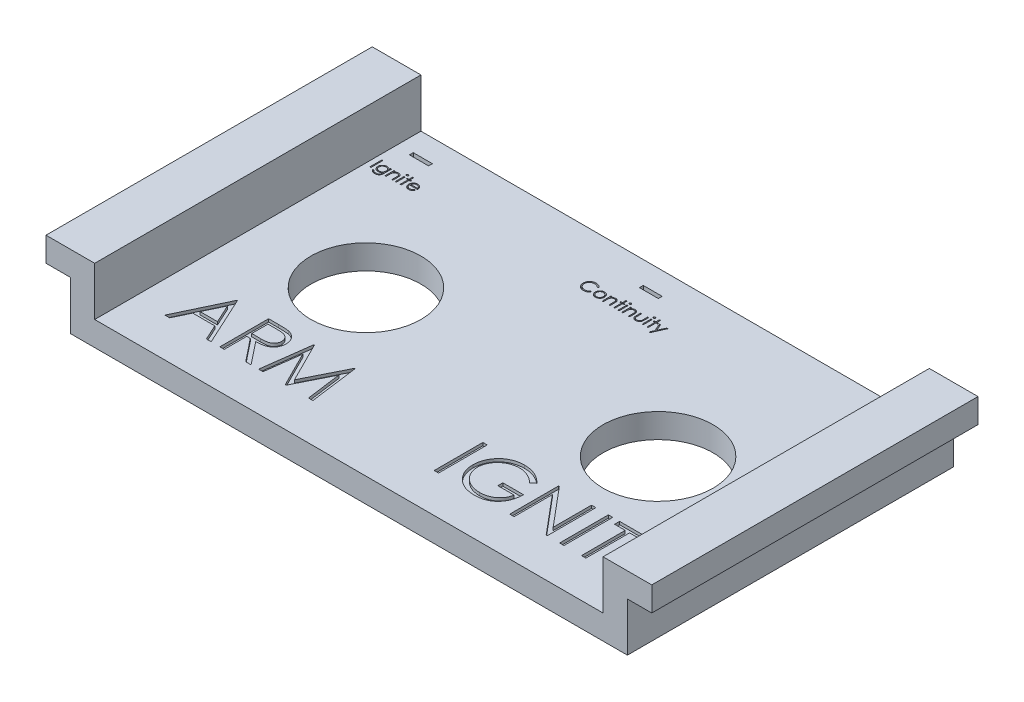
from build123d import *

# Parameters (mm, degrees)
IZIM1_W                     = 145.288
IZIM1_H                     = 85.09
Y_KSEKLIK_EKSTR_ZYON1_DEPTH = 6.35
IZIM2_W                     = 85.09
IZIM2_H                     = 12.7
Y_KSEKLIK_EKSTR_ZYON2_DEPTH = 6.35
IZIM3_W                     = 85.09
IZIM3_H                     = 12.7
Y_KSEKLIK_EKSTR_ZYON3_DEPTH = 6.35
IZIM6_W                     = 85.09
IZIM6_H                     = 6.35
Y_KSEKLIK_EKSTR_ZYON4_DEPTH = 6.35
IZIM4_W                     = 85.09
IZIM4_H                     = 6.35
Y_KSEKLIK_EKSTR_ZYON5_DEPTH = 6.35
IZIM7_R                     = 14.351
KES_EKSTR_ZYON1_DEPTH       = 6.35
IZIM8_R                     = 14.351
KES_EKSTR_ZYON2_DEPTH       = 6.35
IZIM9_W                     = 4
IZIM9_H                     = 1
KES_EKSTR_ZYON3_DEPTH       = 6.35
IZIM10_W                    = 4.922542764
IZIM10_H                    = 1
KES_EKSTR_ZYON4_DEPTH       = 6.35
IZIM11_W                    = 0.284935897
IZIM11_H                    = 2.320192308
KES_EKSTR_ZYON5_DEPTH       = 0.762
IZIM12_W                    = 0.284935897
IZIM12_H                    = 2.320192308
KES_EKSTR_ZYON6_DEPTH       = 0.762
KES_EKSTR_ZYON7_DEPTH       = 0.762
IZIM14_W                    = 1.139743589
IZIM14_H                    = 12.7
KES_EKSTR_ZYON8_DEPTH       = 0.762
IZIM15_W                    = 5
IZIM15_H                    = 1
KES_EKSTR_ZYON9_DEPTH       = 6.35
IZIM16_W                    = 0.284935898
IZIM16_H                    = 3.175
IZIM16_W_2                  = 0.284935897
IZIM16_H_2                  = 2.320192308
KES_EKSTR_ZYON10_DEPTH      = 0.762


with BuildPart() as part:
    # Çizim1 → Yükseklik-Ekstrüzyon1 (new body)
    with BuildSketch(Plane(origin=(0, 0, 0), x_dir=(1, 0, 0), z_dir=(0, 1, 0))):
        Rectangle(IZIM1_W, IZIM1_H)
    extrude(amount=Y_KSEKLIK_EKSTR_ZYON1_DEPTH)

    # Çizim2 → Yükseklik-Ekstrüzyon2 (add)
    with BuildSketch(Plane.ZY.offset(72.644)):
        with Locations((0, 12.7)):
            Rectangle(IZIM2_W, IZIM2_H)
    extrude(amount=-Y_KSEKLIK_EKSTR_ZYON2_DEPTH)

    # Çizim3 → Yükseklik-Ekstrüzyon3 (add)
    with BuildSketch(Plane(origin=(72.644, 0, 0), x_dir=(0, 0, -1), z_dir=(1, 0, 0))):
        with Locations((0, 12.7)):
            Rectangle(IZIM3_W, IZIM3_H)
    extrude(amount=-Y_KSEKLIK_EKSTR_ZYON3_DEPTH)

    # Çizim6 → Yükseklik-Ekstrüzyon4 (add)
    with BuildSketch(Plane.ZY.offset(72.644)):
        with Locations((0, 15.875)):
            Rectangle(IZIM6_W, IZIM6_H)
    extrude(amount=Y_KSEKLIK_EKSTR_ZYON4_DEPTH)

    # Çizim4 → Yükseklik-Ekstrüzyon5 (add)
    with BuildSketch(Plane(origin=(72.644, 0, 0), x_dir=(0, 0, -1), z_dir=(1, 0, 0))):
        with Locations((0, 15.875)):
            Rectangle(IZIM4_W, IZIM4_H)
    extrude(amount=Y_KSEKLIK_EKSTR_ZYON5_DEPTH)

    # Çizim7 → Kes-Ekstrüzyon1 (cut)
    with BuildSketch(Plane(origin=(0, 6.35, 0), x_dir=(1, 0, 0), z_dir=(0, 1, 0))):
        with Locations((-38.1, 0)):
            Circle(IZIM7_R)
    extrude(amount=-KES_EKSTR_ZYON1_DEPTH, mode=Mode.SUBTRACT)

    # Çizim8 → Kes-Ekstrüzyon2 (cut)
    with BuildSketch(Plane(origin=(0, 6.35, 0), x_dir=(1, 0, 0), z_dir=(0, 1, 0))):
        with Locations((38.1, 0)):
            Circle(IZIM8_R)
    extrude(amount=-KES_EKSTR_ZYON2_DEPTH, mode=Mode.SUBTRACT)

    # Çizim9 → Kes-Ekstrüzyon3 (cut)
    with BuildSketch(Plane(origin=(0, 6.35, 0), x_dir=(1, 0, 0), z_dir=(0, 1, 0))):
        with Locations((59.944, 36.195)):
            Rectangle(IZIM9_W, IZIM9_H)
    extrude(amount=-KES_EKSTR_ZYON3_DEPTH, mode=Mode.SUBTRACT)

    # Çizim10 → Kes-Ekstrüzyon4 (cut)
    with BuildSketch(Plane(origin=(0, 6.35, 0), x_dir=(1, 0, 0), z_dir=(0, 1, 0))):
        with Locations((0, 36.195)):
            Rectangle(IZIM10_W, IZIM10_H)
    extrude(amount=-KES_EKSTR_ZYON4_DEPTH, mode=Mode.SUBTRACT)

    # Çizim11 → Kes-Ekstrüzyon5 (cut)
    # profile 1 of 12: a face of its own
    with BuildSketch(Plane(origin=(0, 6.35, 0), x_dir=(1, 0, 0), z_dir=(0, 1, 0))):
        with BuildLine():
            Line((-7.736114872, 30.405407853), (-7.985433783, 30.214602564))
            add(Edge.make_bspline(
                [(-7.985433783, 30.214602564), (-8.003219124, 30.235798837), (-8.038550022, 30.27790561), (-8.09539087, 30.337032768), (-8.154628789, 30.392427684), (-8.216241135, 30.444354246), (-8.281336908, 30.490996598), (-8.348339203, 30.534785384), (-8.418368859, 30.574035404), (-8.515207932, 30.621626827), (-8.64188848, 30.67128941), (-8.801359513, 30.712930199), (-8.967830295, 30.73943798), (-9.081402403, 30.742308943), (-9.13916976, 30.743769231)],
                knots=[0, 0, 0, 0, 0.757959112, 1.505699292, 2.245454638, 2.979532153, 3.711538275, 4.438200793, 5.171680507, 5.909471876, 7.393775596, 8.890124382, 10.418191784, 12, 12, 12, 12], degree=3))
            add(Edge.make_bspline(
                [(-9.13916976, 30.743769231), (-9.170995324, 30.743402779), (-9.234351082, 30.742673277), (-9.328375054, 30.733049285), (-9.420643322, 30.719522687), (-9.511095867, 30.699451858), (-9.59961755, 30.674076696), (-9.686787087, 30.643755071), (-9.771342416, 30.606240323), (-9.854453247, 30.564776402), (-9.934081531, 30.517942934), (-10.009424324, 30.466858679), (-10.080206838, 30.412095284), (-10.146485065, 30.353447495), (-10.208326761, 30.291179431), (-10.265283821, 30.224627492), (-10.317159158, 30.154004449), (-10.364981031, 30.080241573), (-10.407809724, 30.003553719), (-10.443668972, 29.923657048), (-10.475423619, 29.841919754), (-10.500550789, 29.757418344), (-10.520439458, 29.670747406), (-10.534162409, 29.581674334), (-10.543676951, 29.490385211), (-10.544402826, 29.42850962), (-10.544768718, 29.397319912)],
                knots=[0, 0, 0, 0, 1.054917814, 2.100044995, 3.131103042, 4.146048494, 5.169673617, 6.183595914, 7.203665975, 8.234915748, 9.262203917, 10.264457458, 11.251630812, 12.227803204, 13.197192746, 14.159520551, 15.12972552, 16.100847026, 17.073214652, 18.039054194, 19.002613845, 19.979014051, 20.95965708, 21.949030935, 22.966165397, 24, 24, 24, 24], degree=3))
            add(Edge.make_bspline(
                [(-10.544768718, 29.397319912), (-10.543624068, 29.350392215), (-10.5413767, 29.258255905), (-10.521375711, 29.123299709), (-10.490981807, 28.994013097), (-10.445429105, 28.871204241), (-10.38925968, 28.753358801), (-10.318284268, 28.642470699), (-10.236082124, 28.536864244), (-10.141490329, 28.439035284), (-10.03770791, 28.349669262), (-9.926358019, 28.270974091), (-9.807717986, 28.205374162), (-9.683097758, 28.150785982), (-9.551538354, 28.108824522), (-9.413276355, 28.07928421), (-9.268612474, 28.060014518), (-9.169761661, 28.058169672), (-9.119453214, 28.057230769)],
                knots=[0, 0, 0, 0, 1.029171465, 2.020641659, 2.987623507, 3.938342917, 4.889210282, 5.84687017, 6.821220943, 7.821438502, 8.827599549, 9.822697543, 10.807740252, 11.797342354, 12.80366471, 13.83203677, 14.896651826, 16, 16, 16, 16], degree=3))
            add(Edge.make_bspline(
                [(-9.119453214, 28.057230769), (-9.064024346, 28.058762734), (-8.954927074, 28.061778006), (-8.794936079, 28.087322468), (-8.64177792, 28.128740722), (-8.495444359, 28.186705266), (-8.35634793, 28.262057348), (-8.22427096, 28.353404709), (-8.099101964, 28.461616268), (-8.023835158, 28.544241677), (-7.985433783, 28.586397436)],
                knots=[0, 0, 0, 0, 1.028121516, 2.023589091, 2.998037872, 3.967518031, 4.937445131, 5.927275754, 6.942489185, 8, 8, 8, 8], degree=3))
            Line((-7.985433783, 28.586397436), (-7.736114872, 28.3975002))
            add(Edge.make_bspline(
                [(-7.736114872, 28.3975002), (-7.756179158, 28.371611748), (-7.796211622, 28.319958846), (-7.861034251, 28.247140938), (-7.929321514, 28.178647992), (-8.001580622, 28.115032221), (-8.076980333, 28.05502067), (-8.156874502, 28.000318294), (-8.240212839, 27.950161564), (-8.326712973, 27.904235711), (-8.416283001, 27.863489351), (-8.508815595, 27.82860629), (-8.603911903, 27.798557283), (-8.701576271, 27.773835883), (-8.802011279, 27.754539972), (-8.904854495, 27.741640695), (-9.010327882, 27.732803387), (-9.081485457, 27.731997921), (-9.117545161, 27.731589744)],
                knots=[0, 0, 0, 0, 0.986787822, 1.968848986, 2.935600012, 3.899624008, 4.868462664, 5.837806735, 6.815139263, 7.798259679, 8.787526145, 9.778297419, 10.776456485, 11.791383307, 12.812564526, 13.85620153, 14.913611965, 16, 16, 16, 16], degree=3))
            add(Edge.make_bspline(
                [(-9.117545161, 27.731589744), (-9.151693344, 27.731827408), (-9.219217149, 27.732297361), (-9.318911017, 27.739910255), (-9.415965851, 27.750296803), (-9.510104261, 27.765936064), (-9.601839967, 27.784391287), (-9.690341354, 27.809130213), (-9.776479295, 27.836842671), (-9.859907719, 27.869413623), (-9.940697589, 27.906167589), (-10.018588332, 27.947707074), (-10.093544125, 27.993682766), (-10.166301899, 28.04308124), (-10.23578685, 28.097489221), (-10.30260112, 28.156151096), (-10.367119366, 28.218869149), (-10.407036087, 28.264094623), (-10.427105457, 28.286833133)],
                knots=[0, 0, 0, 0, 1.114604814, 2.203992996, 3.262667896, 4.300477797, 5.318619304, 6.316056647, 7.298880507, 8.271930387, 9.238335007, 10.195173496, 11.151986948, 12.108099108, 13.064862484, 14.031167946, 15.010108607, 16, 16, 16, 16], degree=3))
            add(Edge.make_bspline(
                [(-10.427105457, 28.286833133), (-10.459250648, 28.326331212), (-10.523152945, 28.404850513), (-10.604909815, 28.532109939), (-10.674893669, 28.664977528), (-10.73147754, 28.804151321), (-10.775712305, 28.949319022), (-10.806356675, 29.10055381), (-10.826269916, 29.257714444), (-10.828547106, 29.364609245), (-10.829704616, 29.418944511)],
                knots=[0, 0, 0, 0, 0.994628077, 1.977248131, 2.950237994, 3.925870899, 4.908910175, 5.911660606, 6.938484602, 8, 8, 8, 8], degree=3))
            add(Edge.make_bspline(
                [(-10.829704616, 29.418944511), (-10.828293833, 29.476054101), (-10.825518206, 29.588413654), (-10.801936306, 29.753308598), (-10.764000684, 29.911288795), (-10.710119221, 30.062059335), (-10.641806509, 30.206413232), (-10.557418081, 30.343247753), (-10.457934316, 30.473437993), (-10.344135451, 30.595008518), (-10.219342225, 30.706169216), (-10.085703016, 30.803964844), (-9.943479392, 30.885351447), (-9.794238198, 30.95338368), (-9.636861901, 31.005675443), (-9.471686274, 31.042281549), (-9.299021687, 31.065066361), (-9.181217915, 31.067946728), (-9.121361266, 31.069410256)],
                knots=[0, 0, 0, 0, 1.032925535, 2.032216505, 3.007276963, 3.968222605, 4.92396291, 5.891752235, 6.871517503, 7.883894988, 8.900124299, 9.891468569, 10.874487609, 11.85992873, 12.854644235, 13.869047385, 14.917252991, 16, 16, 16, 16], degree=3))
            add(Edge.make_bspline(
                [(-9.121361266, 31.069410256), (-9.084880996, 31.068972888), (-9.012671973, 31.068107162), (-8.905853495, 31.059665162), (-8.801856527, 31.045592104), (-8.700609422, 31.026436813), (-8.60161962, 31.002663028), (-8.505643688, 30.9716929), (-8.41211845, 30.93628119), (-8.321633755, 30.895497439), (-8.234623742, 30.849716895), (-8.15111551, 30.799447007), (-8.071772388, 30.744750098), (-7.996036076, 30.68609136), (-7.925173513, 30.62222981), (-7.857172743, 30.554921991), (-7.79434305, 30.482229165), (-7.755559795, 30.431061832), (-7.736114872, 30.405407853)],
                knots=[0, 0, 0, 0, 1.096760587, 2.17092713, 3.219439832, 4.250915756, 5.268269357, 6.278326846, 7.281116186, 8.274029601, 9.260640565, 10.235837813, 11.203064059, 12.156899882, 13.114053108, 14.069676657, 15.032185724, 16, 16, 16, 16], degree=3))
        make_face()
    # profile 2 of 12: a face of its own
    with BuildSketch(Plane(origin=(0, 6.35, 0), x_dir=(1, 0, 0), z_dir=(0, 1, 0))):
        with BuildLine():
            add(Edge.make_bspline(
                [(-6.045580016, 30.173897436), (-6.002045076, 30.172970435), (-5.916683697, 30.171152812), (-5.791672258, 30.151726379), (-5.672342028, 30.122019841), (-5.558235982, 30.080952067), (-5.450815485, 30.025904869), (-5.348515857, 29.960219298), (-5.25161757, 29.882402231), (-5.193539536, 29.822205983), (-5.164059584, 29.791650841)],
                knots=[0, 0, 0, 0, 1.054011418, 2.066658804, 3.057071809, 4.030435133, 4.997543892, 5.974964718, 6.972108034, 8, 8, 8, 8], degree=3))
            add(Edge.make_bspline(
                [(-5.164059584, 29.791650841), (-5.138675954, 29.762428154), (-5.088399938, 29.70454832), (-5.023933178, 29.610699299), (-4.968396477, 29.513507922), (-4.923889363, 29.411683562), (-4.88879652, 29.30611511), (-4.86388121, 29.196439714), (-4.849061276, 29.082899585), (-4.84706287, 29.00578896), (-4.84605077, 28.966735978)],
                knots=[0, 0, 0, 0, 1.025258237, 2.030674902, 3.01204498, 3.988269485, 4.97094183, 5.956517959, 6.965070386, 8, 8, 8, 8], degree=3))
            add(Edge.make_bspline(
                [(-4.84605077, 28.966735978), (-4.846940983, 28.92745664), (-4.848700086, 28.849838836), (-4.865340366, 28.735521268), (-4.891222137, 28.624673108), (-4.928262447, 28.517758435), (-4.975758732, 28.414450442), (-5.033716713, 28.315200351), (-5.102543108, 28.219812344), (-5.18056102, 28.129096391), (-5.26678665, 28.045488468), (-5.360327728, 27.972619252), (-5.45934603, 27.910188297), (-5.565158214, 27.859899549), (-5.676798006, 27.820248606), (-5.794506204, 27.792399306), (-5.918099946, 27.775561207), (-6.002488925, 27.773398966), (-6.045580016, 27.772294872)],
                knots=[0, 0, 0, 0, 0.998656419, 1.973391657, 2.932242238, 3.890759089, 4.846373663, 5.82037756, 6.809684879, 7.83454468, 8.860553229, 9.859544525, 10.845671541, 11.83227036, 12.833544569, 13.85385346, 14.904124723, 16, 16, 16, 16], degree=3))
            add(Edge.make_bspline(
                [(-6.045580016, 27.772294872), (-6.088882226, 27.773402671), (-6.173691792, 27.775572352), (-6.29772179, 27.792333887), (-6.415640944, 27.820235772), (-6.527426887, 27.860029854), (-6.633693998, 27.910189905), (-6.733286035, 27.972430509), (-6.826903101, 28.045510078), (-6.913146973, 28.129090535), (-6.991159993, 28.219813853), (-7.059987651, 28.315199959), (-7.117945304, 28.414450544), (-7.165441674, 28.517758408), (-7.202481962, 28.624673115), (-7.228363739, 28.735521266), (-7.245004018, 28.849838836), (-7.246763121, 28.92745664), (-7.247653334, 28.966735978)],
                knots=[0, 0, 0, 0, 1.099876186, 2.154163076, 3.173186993, 4.173200201, 5.163417411, 6.152872554, 7.150605724, 8.17532212, 9.198891216, 10.186952605, 11.159729845, 12.11414092, 13.071450619, 14.029093627, 15.002601286, 16, 16, 16, 16], degree=3))
            add(Edge.make_bspline(
                [(-7.247653334, 28.966735978), (-7.246634331, 29.005576701), (-7.24461688, 29.082474659), (-7.229811847, 29.19580135), (-7.204993728, 29.305291124), (-7.169858818, 29.410452092), (-7.124941466, 29.511830237), (-7.070185155, 29.609261763), (-7.005060796, 29.70268641), (-6.95498474, 29.76049144), (-6.92964452, 29.789742788)],
                knots=[0, 0, 0, 0, 1.031353054, 2.041901799, 3.029428768, 4.008703097, 4.981709435, 5.96992636, 6.972712378, 8, 8, 8, 8], degree=3))
            add(Edge.make_bspline(
                [(-6.92964452, 29.789742788), (-6.900209012, 29.820562912), (-6.842318907, 29.881176108), (-6.744938275, 29.958766326), (-6.642890309, 30.025818764), (-6.534282698, 30.079772189), (-6.420270391, 30.122261415), (-6.300328649, 30.15180299), (-6.174893003, 30.171082819), (-6.089113918, 30.17294988), (-6.045580016, 30.173897436)],
                knots=[0, 0, 0, 0, 1.027980169, 2.021703884, 2.998553061, 3.971491411, 4.943284454, 5.930300938, 6.949603206, 8, 8, 8, 8], degree=3))
        make_face()
        with BuildLine():
            add(Edge.make_bspline(
                [(-6.046852052, 29.888961538), (-6.077638313, 29.888086516), (-6.138416094, 29.88635906), (-6.227878146, 29.873220089), (-6.314002429, 29.852403425), (-6.396952337, 29.822826888), (-6.476448144, 29.784637172), (-6.552565959, 29.737730303), (-6.625529672, 29.682727549), (-6.693911973, 29.619714983), (-6.756670213, 29.550881895), (-6.811532377, 29.477540884), (-6.858182295, 29.400881555), (-6.897044439, 29.320824192), (-6.925988817, 29.236557503), (-6.947010059, 29.149035787), (-6.960136634, 29.058080731), (-6.961847849, 28.99624895), (-6.962717436, 28.964827925)],
                knots=[0, 0, 0, 0, 1.021534396, 2.016698045, 2.994645724, 3.958388632, 4.93408049, 5.916473867, 6.921342795, 7.962252576, 8.998418191, 10.008913653, 10.997312074, 11.973003931, 12.956656626, 13.948281152, 14.957379055, 16, 16, 16, 16], degree=3))
            add(Edge.make_bspline(
                [(-6.962717436, 28.964827925), (-6.961259818, 28.924231443), (-6.958366717, 28.843655018), (-6.934839753, 28.724990642), (-6.895482199, 28.611069962), (-6.842335167, 28.502560812), (-6.77574524, 28.402165246), (-6.697289115, 28.312656113), (-6.607808815, 28.235380413), (-6.50837099, 28.171262789), (-6.401006716, 28.120317867), (-6.287381339, 28.084214511), (-6.168871567, 28.06074519), (-6.087881189, 28.058412495), (-6.046852052, 28.057230769)],
                knots=[0, 0, 0, 0, 1.016792936, 2.018143844, 3.017858371, 4.030088057, 5.03801393, 6.028138512, 7.003788237, 7.991172063, 8.984598303, 9.972568034, 10.972917682, 12, 12, 12, 12], degree=3))
            add(Edge.make_bspline(
                [(-6.046852052, 28.057230769), (-6.005825274, 28.058419381), (-5.924839555, 28.060765666), (-5.806494445, 28.08409631), (-5.693179627, 28.120476059), (-5.585926869, 28.171205493), (-5.486534307, 28.235623898), (-5.396410461, 28.312219754), (-5.318624221, 28.402402319), (-5.252100165, 28.502693792), (-5.198082763, 28.61090174), (-5.15890943, 28.725011668), (-5.135325905, 28.843649663), (-5.132440439, 28.924229649), (-5.130986667, 28.964827925)],
                knots=[0, 0, 0, 0, 1.02726834, 2.027799167, 3.010890988, 4.004497153, 4.992059811, 5.971914811, 6.958719428, 7.966827853, 8.981595046, 9.981490638, 10.983022906, 12, 12, 12, 12], degree=3))
            add(Edge.make_bspline(
                [(-5.130986667, 28.964827925), (-5.131855955, 28.996249138), (-5.133566581, 29.058081288), (-5.146697441, 29.149033657), (-5.167702824, 29.236565319), (-5.196705648, 29.320795351), (-5.235398932, 29.401088837), (-5.282948451, 29.477315804), (-5.337586596, 29.551135956), (-5.401102127, 29.619492473), (-5.469413048, 29.682752114), (-5.542406333, 29.737751631), (-5.618411278, 29.784431021), (-5.697676135, 29.82315354), (-5.780636678, 29.852134341), (-5.866640288, 29.873340285), (-5.955720637, 29.886303535), (-6.016280627, 29.888069871), (-6.046852052, 29.888961538)],
                knots=[0, 0, 0, 0, 1.042956736, 2.052379634, 3.044323526, 4.02829302, 5.004299113, 5.996692471, 7.007513377, 8.048758398, 9.090003419, 10.095195979, 11.07790575, 12.047570684, 13.018257071, 13.989683339, 14.985167495, 16, 16, 16, 16], degree=3))
        make_face(mode=Mode.SUBTRACT)
    # profile 3 of 12: a face of its own
    with BuildSketch(Plane(origin=(0, 6.35, 0), x_dir=(1, 0, 0), z_dir=(0, 1, 0))):
        with BuildLine():
            Line((-4.276178975, 30.133192308), (-3.991243077, 30.133192308))
            Line((-3.991243077, 30.133192308), (-3.991243077, 29.714692708))
            add(Edge.make_bspline(
                [(-3.991243077, 29.714692708), (-3.960819651, 29.752650035), (-3.901781931, 29.826307553), (-3.803461858, 29.92311836), (-3.699554177, 30.002897243), (-3.590695216, 30.066491399), (-3.4767372, 30.114430838), (-3.358374769, 30.14905279), (-3.234899286, 30.169812599), (-3.150930118, 30.172525165), (-3.108450609, 30.173897436)],
                knots=[0, 0, 0, 0, 1.12780773, 2.188550248, 3.19190651, 4.159438251, 5.104880172, 6.052711206, 7.014878035, 8, 8, 8, 8], degree=3))
            add(Edge.make_bspline(
                [(-3.108450609, 30.173897436), (-3.065514963, 30.172314294), (-2.981479546, 30.169215704), (-2.859125876, 30.144707706), (-2.744850011, 30.102847367), (-2.639059414, 30.045504989), (-2.543694014, 29.974197688), (-2.459942184, 29.891123558), (-2.39066981, 29.795568682), (-2.344226488, 29.706919819), (-2.313632507, 29.628280699), (-2.294371744, 29.56092829), (-2.278015068, 29.48589111), (-2.263834839, 29.403395911), (-2.254239888, 29.312864696), (-2.246672238, 29.214668575), (-2.241248708, 29.108839357), (-2.241033527, 29.035645059), (-2.240922565, 28.997900841)],
                knots=[0, 0, 0, 0, 1.235846778, 2.418850247, 3.575807741, 4.728682307, 5.871620074, 6.994088408, 8.11269785, 9.256955736, 9.865816715, 10.540099792, 11.271859618, 12.076849838, 12.949306005, 13.892391288, 14.913166135, 16, 16, 16, 16], degree=3))
            Line((-2.240922565, 28.997900841), (-2.240922565, 27.813))
            Line((-2.240922565, 27.813), (-2.525858462, 27.813))
            Line((-2.525858462, 27.813), (-2.525858462, 28.90440625))
            add(Edge.make_bspline(
                [(-2.525858462, 28.90440625), (-2.526033729, 28.935995182), (-2.526368986, 28.996419433), (-2.527426394, 29.082932762), (-2.52997529, 29.161388443), (-2.533556974, 29.231598912), (-2.53879938, 29.29349675), (-2.544262767, 29.347208022), (-2.550943853, 29.392664536), (-2.556897353, 29.420028575), (-2.559567396, 29.432300881)],
                knots=[0, 0, 0, 0, 1.430800155, 2.736877192, 3.918605307, 4.986035426, 5.920637409, 6.731861385, 7.431261377, 8, 8, 8, 8], degree=3))
            add(Edge.make_bspline(
                [(-2.559567396, 29.432300881), (-2.569206271, 29.468324599), (-2.587758123, 29.53765911), (-2.633599665, 29.631706559), (-2.691488244, 29.711714915), (-2.762152721, 29.777189512), (-2.844910526, 29.828144486), (-2.939532005, 29.86349943), (-3.045104058, 29.885612189), (-3.119357676, 29.887813944), (-3.158059984, 29.888961538)],
                knots=[0, 0, 0, 0, 1.084156227, 2.086665306, 3.027808233, 3.945421172, 4.874247719, 5.839848303, 6.874090471, 8, 8, 8, 8], degree=3))
            add(Edge.make_bspline(
                [(-3.158059984, 29.888961538), (-3.180981383, 29.888529734), (-3.226342239, 29.887675205), (-3.293606856, 29.879101527), (-3.358852356, 29.8650785), (-3.422733546, 29.846147664), (-3.483972759, 29.820146892), (-3.544537509, 29.790638106), (-3.602147216, 29.753855085), (-3.658030298, 29.712860735), (-3.710021202, 29.66743174), (-3.758397623, 29.61949422), (-3.801521399, 29.568444208), (-3.84059084, 29.515104256), (-3.874316836, 29.458741803), (-3.903756423, 29.399900611), (-3.928735232, 29.338503233), (-3.941147388, 29.295890141), (-3.947357861, 29.27456851)],
                knots=[0, 0, 0, 0, 1.023777757, 2.026029729, 3.023749952, 4.003683103, 4.997618607, 5.993177895, 7.010360494, 8.046726602, 9.087585522, 10.09234134, 11.086953743, 12.070360549, 13.043493632, 14.017870808, 15.008233677, 16, 16, 16, 16], degree=3))
            add(Edge.make_bspline(
                [(-3.947357861, 29.27456851), (-3.950931685, 29.258915575), (-3.958711713, 29.224839956), (-3.967114741, 29.168919662), (-3.974741613, 29.104231327), (-3.981125139, 29.03085044), (-3.985030767, 28.948520082), (-3.989289256, 28.857591857), (-3.990839618, 28.757703193), (-3.991104825, 28.688160086), (-3.991243077, 28.651907252)],
                knots=[0, 0, 0, 0, 0.615963638, 1.340920617, 2.168419149, 3.115676021, 4.16674242, 5.331190069, 6.6087489, 8, 8, 8, 8], degree=3))
            Line((-3.991243077, 28.651907252), (-3.991243077, 27.813))
            Line((-3.991243077, 27.813), (-4.276178975, 27.813))
            Line((-4.276178975, 27.813), (-4.276178975, 30.133192308))
        make_face()
    # profile 4 of 12: a face of its own
    with BuildSketch(Plane(origin=(0, 6.35, 0), x_dir=(1, 0, 0), z_dir=(0, 1, 0))):
        Polygon((-1.304704616, 31.069410256), (-1.019768718, 31.069410256), (-1.019768718, 30.133192308), (-0.612717436, 30.133192308), (-0.612717436, 29.84825641), (-1.019768718, 29.84825641), (-1.019768718, 27.813), (-1.304704616, 27.813), (-1.304704616, 29.84825641), (-1.711755898, 29.84825641), (-1.711755898, 30.133192308), (-1.304704616, 30.133192308), align=None)
    # profile 5 of 12: a face of its own
    with BuildSketch(Plane(origin=(0, 6.35, 0), x_dir=(1, 0, 0), z_dir=(0, 1, 0))):
        with BuildLine():
            add(Edge.make_bspline(
                [(-0.023765113, 31.110115385), (-0.006083705, 31.109295189), (0.028539888, 31.107689089), (0.078608066, 31.093935463), (0.124198356, 31.070622177), (0.164636728, 31.039344181), (0.199336654, 31.002560043), (0.223630584, 30.959687593), (0.239244686, 30.913370114), (0.241130233, 30.88106214), (0.242090256, 30.86461258)],
                knots=[0, 0, 0, 0, 1.055194115, 2.066272739, 3.074728998, 4.095836921, 5.109056067, 6.073838105, 7.019297344, 8, 8, 8, 8], degree=3))
            add(Edge.make_bspline(
                [(0.242090256, 30.86461258), (0.241108582, 30.84859003), (0.23916793, 30.816915346), (0.223642644, 30.771400839), (0.199129614, 30.729124096), (0.164658979, 30.692411381), (0.12419246, 30.661150675), (0.078609633, 30.637832805), (0.028539476, 30.624080395), (-0.006083844, 30.622474127), (-0.023765113, 30.621653846)],
                knots=[0, 0, 0, 0, 0.96129708, 1.900370562, 2.859976407, 3.87933698, 4.906634145, 5.921202961, 6.938410037, 8, 8, 8, 8], degree=3))
            add(Edge.make_bspline(
                [(-0.023765113, 30.621653846), (-0.041244191, 30.622442807), (-0.075264933, 30.623978415), (-0.124583426, 30.638102646), (-0.169784984, 30.661158655), (-0.210302223, 30.692206694), (-0.244075326, 30.729349565), (-0.268657379, 30.771375039), (-0.284146808, 30.816921915), (-0.286092293, 30.848592237), (-0.287076411, 30.86461258)],
                knots=[0, 0, 0, 0, 1.054934014, 2.053291228, 3.073705704, 4.106921865, 5.123545215, 6.088680038, 7.033164197, 8, 8, 8, 8], degree=3))
            add(Edge.make_bspline(
                [(-0.287076411, 30.86461258), (-0.286113854, 30.881059851), (-0.284223331, 30.913363328), (-0.268645768, 30.959713822), (-0.244280085, 31.002332756), (-0.21027986, 31.039548745), (-0.169790935, 31.070614247), (-0.124581888, 31.093665637), (-0.075265339, 31.107791066), (-0.041244329, 31.109326509), (-0.023765113, 31.110115385)],
                knots=[0, 0, 0, 0, 0.98631895, 1.937192651, 2.907499808, 3.917963147, 4.944918757, 5.95915025, 6.951458133, 8, 8, 8, 8], degree=3))
        make_face()
    # profile 6 of 12: a face of its own
    with BuildSketch(Plane(origin=(0, 6.35, 0), x_dir=(1, 0, 0), z_dir=(0, 1, 0))):
        with Locations((-0.022493077, 28.973096154)):
            Rectangle(IZIM11_W, IZIM11_H)
    # profile 7 of 12: a face of its own
    with BuildSketch(Plane(origin=(0, 6.35, 0), x_dir=(1, 0, 0), z_dir=(0, 1, 0))):
        with BuildLine():
            Line((0.811962051, 30.133192308), (1.096897948, 30.133192308))
            Line((1.096897948, 30.133192308), (1.096897948, 29.714692708))
            add(Edge.make_bspline(
                [(1.096897948, 29.714692708), (1.127321374, 29.752650035), (1.186359094, 29.826307553), (1.284679168, 29.92311836), (1.388586849, 30.002897243), (1.497445809, 30.066491399), (1.611403826, 30.114430838), (1.729766256, 30.14905279), (1.85324174, 30.169812599), (1.937210907, 30.172525165), (1.979690416, 30.173897436)],
                knots=[0, 0, 0, 0, 1.12780773, 2.188550248, 3.19190651, 4.159438251, 5.104880172, 6.052711206, 7.014878035, 8, 8, 8, 8], degree=3))
            add(Edge.make_bspline(
                [(1.979690416, 30.173897436), (2.022626063, 30.172314294), (2.10666148, 30.169215704), (2.22901515, 30.144707706), (2.343291014, 30.102847367), (2.449081611, 30.045504989), (2.544447012, 29.974197688), (2.628198842, 29.891123558), (2.697471216, 29.795568682), (2.743914538, 29.706919819), (2.774508519, 29.628280699), (2.793769282, 29.56092829), (2.810125958, 29.48589111), (2.824306186, 29.403395911), (2.833901138, 29.312864696), (2.841468788, 29.214668575), (2.846892318, 29.108839357), (2.847107499, 29.035645059), (2.847218461, 28.997900841)],
                knots=[0, 0, 0, 0, 1.235846778, 2.418850247, 3.575807741, 4.728682307, 5.871620074, 6.994088408, 8.11269785, 9.256955736, 9.865816715, 10.540099792, 11.271859618, 12.076849838, 12.949306005, 13.892391288, 14.913166135, 16, 16, 16, 16], degree=3))
            Line((2.847218461, 28.997900841), (2.847218461, 27.813))
            Line((2.847218461, 27.813), (2.562282564, 27.813))
            Line((2.562282564, 27.813), (2.562282564, 28.90440625))
            add(Edge.make_bspline(
                [(2.562282564, 28.90440625), (2.562107296, 28.935995182), (2.56177204, 28.996419433), (2.560714632, 29.082932762), (2.558165736, 29.161388443), (2.554584052, 29.231598912), (2.549341646, 29.29349675), (2.543878259, 29.347208022), (2.537197173, 29.392664536), (2.531243673, 29.420028575), (2.528573629, 29.432300881)],
                knots=[0, 0, 0, 0, 1.430800155, 2.736877192, 3.918605307, 4.986035426, 5.920637409, 6.731861385, 7.431261377, 8, 8, 8, 8], degree=3))
            add(Edge.make_bspline(
                [(2.528573629, 29.432300881), (2.518934754, 29.468324599), (2.500382902, 29.53765911), (2.45454136, 29.631706559), (2.396652782, 29.711714915), (2.325988304, 29.777189512), (2.2432305, 29.828144486), (2.148609021, 29.86349943), (2.043036968, 29.885612189), (1.968783349, 29.887813944), (1.930081041, 29.888961538)],
                knots=[0, 0, 0, 0, 1.084156227, 2.086665306, 3.027808233, 3.945421172, 4.874247719, 5.839848303, 6.874090471, 8, 8, 8, 8], degree=3))
            add(Edge.make_bspline(
                [(1.930081041, 29.888961538), (1.907159643, 29.888529734), (1.861798787, 29.887675205), (1.794534169, 29.879101527), (1.729288669, 29.8650785), (1.66540748, 29.846147664), (1.604168267, 29.820146892), (1.543603517, 29.790638106), (1.48599381, 29.753855085), (1.430110728, 29.712860735), (1.378119824, 29.66743174), (1.329743403, 29.61949422), (1.286619627, 29.568444208), (1.247550186, 29.515104256), (1.21382419, 29.458741803), (1.184384603, 29.399900611), (1.159405794, 29.338503233), (1.146993637, 29.295890141), (1.140783165, 29.27456851)],
                knots=[0, 0, 0, 0, 1.023777757, 2.026029729, 3.023749952, 4.003683103, 4.997618607, 5.993177895, 7.010360494, 8.046726602, 9.087585522, 10.09234134, 11.086953743, 12.070360549, 13.043493632, 14.017870808, 15.008233677, 16, 16, 16, 16], degree=3))
            add(Edge.make_bspline(
                [(1.140783165, 29.27456851), (1.137209341, 29.258915575), (1.129429312, 29.224839956), (1.121026285, 29.168919662), (1.113399413, 29.104231327), (1.107015886, 29.03085044), (1.103110259, 28.948520082), (1.09885177, 28.857591857), (1.097301407, 28.757703193), (1.097036201, 28.688160086), (1.096897948, 28.651907252)],
                knots=[0, 0, 0, 0, 0.615963638, 1.340920617, 2.168419149, 3.115676021, 4.16674242, 5.331190069, 6.6087489, 8, 8, 8, 8], degree=3))
            Line((1.096897948, 28.651907252), (1.096897948, 27.813))
            Line((1.096897948, 27.813), (0.811962051, 27.813))
            Line((0.811962051, 27.813), (0.811962051, 30.133192308))
        make_face()
    # profile 8 of 12: a face of its own
    with BuildSketch(Plane(origin=(0, 6.35, 0), x_dir=(1, 0, 0), z_dir=(0, 1, 0))):
        with BuildLine():
            Line((3.457795384, 30.133192308), (3.742731282, 30.133192308))
            Line((3.742731282, 30.133192308), (3.742731282, 29.057050481))
            add(Edge.make_bspline(
                [(3.742731282, 29.057050481), (3.74286001, 29.025461273), (3.74310626, 28.965032597), (3.744776257, 28.878078249), (3.74870427, 28.798778803), (3.753615382, 28.727088448), (3.759931034, 28.663019315), (3.767445226, 28.606795184), (3.775843937, 28.55777846), (3.784065113, 28.528256987), (3.787888533, 28.514527444)],
                knots=[0, 0, 0, 0, 1.388932606, 2.656963016, 3.823490214, 4.879454478, 5.816252168, 6.653371382, 7.373723809, 8, 8, 8, 8], degree=3))
            add(Edge.make_bspline(
                [(3.787888533, 28.514527444), (3.794022139, 28.497270982), (3.806161834, 28.463116817), (3.828181351, 28.413778219), (3.855421342, 28.368080642), (3.8852299, 28.324261947), (3.919610077, 28.283620145), (3.958126883, 28.246223867), (3.999490998, 28.210660155), (4.060954484, 28.168582523), (4.145009675, 28.123483616), (4.255366103, 28.084570981), (4.375022079, 28.06131563), (4.457721503, 28.058617556), (4.500228277, 28.057230769)],
                knots=[0, 0, 0, 0, 0.725840625, 1.436591201, 2.137033971, 2.831655856, 3.53531722, 4.242432219, 4.957935707, 5.694543706, 7.190802206, 8.724350549, 10.316345118, 12, 12, 12, 12], degree=3))
            add(Edge.make_bspline(
                [(4.500228277, 28.057230769), (4.542731102, 28.058647045), (4.624966204, 28.061387276), (4.743307497, 28.083869486), (4.851485566, 28.121430361), (4.948414643, 28.173869942), (5.033655084, 28.238043099), (5.104688378, 28.313343946), (5.163296388, 28.397390176), (5.188886362, 28.460095772), (5.201755721, 28.491630809)],
                knots=[0, 0, 0, 0, 1.157059328, 2.238695713, 3.266970494, 4.264342957, 5.228770407, 6.160125903, 7.074715775, 8, 8, 8, 8], degree=3))
            add(Edge.make_bspline(
                [(5.201755721, 28.491630809), (5.205560487, 28.504300237), (5.213971895, 28.532309249), (5.223009171, 28.579825163), (5.231150289, 28.636489483), (5.238101885, 28.702673001), (5.243059568, 28.778202761), (5.245732035, 28.863055158), (5.248751256, 28.956963821), (5.248797082, 29.022702431), (5.248821025, 29.057050481)],
                knots=[0, 0, 0, 0, 0.557542046, 1.232589297, 2.036731608, 2.971723315, 4.038036528, 5.22795436, 6.551621927, 8, 8, 8, 8], degree=3))
            Line((5.248821025, 29.057050481), (5.248821025, 30.133192308))
            Line((5.248821025, 30.133192308), (5.533756923, 30.133192308))
            Line((5.533756923, 30.133192308), (5.533756923, 29.003625))
            add(Edge.make_bspline(
                [(5.533756923, 29.003625), (5.533356242, 28.965246352), (5.532578868, 28.890786524), (5.52758292, 28.782578794), (5.519010772, 28.681738758), (5.505999908, 28.588213037), (5.490700331, 28.502073036), (5.470964284, 28.423208352), (5.447398311, 28.351861971), (5.420814022, 28.286781931), (5.389407042, 28.227775105), (5.355999674, 28.1717719), (5.317423631, 28.120161881), (5.276810633, 28.070375942), (5.231633416, 28.024890413), (5.182738544, 27.982661575), (5.130814213, 27.943043896), (5.074708155, 27.907582521), (5.015239441, 27.875635993), (4.952334656, 27.84731855), (4.885223322, 27.824909784), (4.814771309, 27.805577966), (4.740633445, 27.790415554), (4.662881202, 27.779723455), (4.581540772, 27.773169047), (4.526105762, 27.772591157), (4.497684206, 27.772294872)],
                knots=[0, 0, 0, 0, 1.493040784, 2.896703357, 4.213163133, 5.428574705, 6.569057535, 7.615249723, 8.588095153, 9.490268104, 10.346124644, 11.18633936, 12.024365274, 12.850166724, 13.684164916, 14.514361689, 15.362232829, 16.222528818, 17.093394965, 17.986930858, 18.902426812, 19.842810585, 20.827885679, 21.843828298, 22.894529745, 24, 24, 24, 24], degree=3))
            add(Edge.make_bspline(
                [(4.497684206, 27.772294872), (4.469475226, 27.772603035), (4.414041953, 27.773208604), (4.332697324, 27.779687243), (4.25472966, 27.790398941), (4.180416155, 27.805689031), (4.109682238, 27.824774473), (4.042241391, 27.847456252), (3.978883302, 27.875650689), (3.91884677, 27.90738033), (3.862601746, 27.943271687), (3.809888965, 27.982612694), (3.760779106, 28.025344623), (3.715261337, 28.071289011), (3.673974565, 28.121015804), (3.636404299, 28.17412499), (3.601972145, 28.230090342), (3.570809257, 28.290019068), (3.544037878, 28.355852249), (3.520402048, 28.428693187), (3.501070255, 28.50934047), (3.485338158, 28.597725148), (3.472682209, 28.693424221), (3.463895494, 28.796991284), (3.458982562, 28.908174061), (3.458199642, 28.984963605), (3.457795384, 29.024613582)],
                knots=[0, 0, 0, 0, 1.083640291, 2.129454052, 3.13281866, 4.105697902, 5.042300162, 5.946461698, 6.836384745, 7.703652036, 8.553297018, 9.397182691, 10.228592656, 11.052265423, 11.879314572, 12.708807002, 13.549817954, 14.402308542, 15.300838682, 16.27712199, 17.341985831, 18.484375296, 19.725102775, 21.0496083, 22.476576903, 24, 24, 24, 24], degree=3))
            Line((3.457795384, 29.024613582), (3.457795384, 30.133192308))
        make_face()
    # profile 9 of 12: a face of its own
    with BuildSketch(Plane(origin=(0, 6.35, 0), x_dir=(1, 0, 0), z_dir=(0, 1, 0))):
        with BuildLine():
            add(Edge.make_bspline(
                [(6.285529759, 31.110115385), (6.303211167, 31.109295189), (6.33783476, 31.107689089), (6.387902938, 31.093935463), (6.433493228, 31.070622177), (6.4739316, 31.039344181), (6.508631525, 31.002560043), (6.532925456, 30.959687593), (6.548539558, 30.913370114), (6.550425104, 30.88106214), (6.551385128, 30.86461258)],
                knots=[0, 0, 0, 0, 1.055194115, 2.066272739, 3.074728998, 4.095836921, 5.109056067, 6.073838105, 7.019297344, 8, 8, 8, 8], degree=3))
            add(Edge.make_bspline(
                [(6.551385128, 30.86461258), (6.550403454, 30.84859003), (6.548462802, 30.816915346), (6.532937516, 30.771400839), (6.508424486, 30.729124096), (6.473953851, 30.692411381), (6.433487332, 30.661150675), (6.387904504, 30.637832805), (6.337834348, 30.624080395), (6.303211028, 30.622474127), (6.285529759, 30.621653846)],
                knots=[0, 0, 0, 0, 0.96129708, 1.900370562, 2.859976407, 3.87933698, 4.906634145, 5.921202961, 6.938410037, 8, 8, 8, 8], degree=3))
            add(Edge.make_bspline(
                [(6.285529759, 30.621653846), (6.268050681, 30.622442807), (6.234029939, 30.623978415), (6.184711446, 30.638102646), (6.139509888, 30.661158655), (6.098992649, 30.692206694), (6.065219545, 30.729349565), (6.040637493, 30.771375039), (6.025148063, 30.816921915), (6.023202579, 30.848592237), (6.022218461, 30.86461258)],
                knots=[0, 0, 0, 0, 1.054934014, 2.053291228, 3.073705704, 4.106921865, 5.123545215, 6.088680038, 7.033164197, 8, 8, 8, 8], degree=3))
            add(Edge.make_bspline(
                [(6.022218461, 30.86461258), (6.023181018, 30.881059851), (6.025071541, 30.913363328), (6.040649104, 30.959713822), (6.065014786, 31.002332756), (6.099015012, 31.039548745), (6.139503937, 31.070614247), (6.184712984, 31.093665637), (6.234029533, 31.107791066), (6.268050543, 31.109326509), (6.285529759, 31.110115385)],
                knots=[0, 0, 0, 0, 0.98631895, 1.937192651, 2.907499808, 3.917963147, 4.944918757, 5.95915025, 6.951458133, 8, 8, 8, 8], degree=3))
        make_face()
    # profile 10 of 12: a face of its own
    with BuildSketch(Plane(origin=(0, 6.35, 0), x_dir=(1, 0, 0), z_dir=(0, 1, 0))):
        with Locations((6.286801795, 28.973096154)):
            Rectangle(IZIM11_W, IZIM11_H)
    # profile 11 of 12: a face of its own
    with BuildSketch(Plane(origin=(0, 6.35, 0), x_dir=(1, 0, 0), z_dir=(0, 1, 0))):
        Polygon((7.40619282, 31.069410256), (7.691128717, 31.069410256), (7.691128717, 30.133192308), (8.09818, 30.133192308), (8.09818, 29.84825641), (7.691128717, 29.84825641), (7.691128717, 27.813), (7.40619282, 27.813), (7.40619282, 29.84825641), (6.999141538, 29.84825641), (6.999141538, 30.133192308), (7.40619282, 30.133192308), align=None)
    # profile 12 of 12: a face of its own
    with BuildSketch(Plane(origin=(0, 6.35, 0), x_dir=(1, 0, 0), z_dir=(0, 1, 0))):
        Polygon((8.342410769, 30.133192308), (8.649607283, 30.133192308), (9.435089054, 28.356159054), (10.23265516, 30.133192308), (10.540487692, 30.133192308), (9.115808205, 26.958192308), (8.807975673, 26.958192308), (9.28053677, 28.010801482), align=None)
    extrude(amount=-KES_EKSTR_ZYON5_DEPTH, mode=Mode.SUBTRACT)

    # Çizim12 → Kes-Ekstrüzyon6 (cut)
    # profile 1 of 6: a face of its own
    with BuildSketch(Plane(origin=(0, 6.35, 0), x_dir=(1, 0, 0), z_dir=(0, 1, 0))):
        with BuildLine():
            Line((53.795098431, 30.988), (54.430480042, 30.988))
            add(Edge.make_bspline(
                [(54.430480042, 30.988), (54.472880923, 30.987858861), (54.554295311, 30.987587859), (54.670929635, 30.986076774), (54.776908501, 30.981745752), (54.872176498, 30.97801868), (54.956731878, 30.971222418), (55.030833921, 30.964726689), (55.094141332, 30.956223439), (55.132464354, 30.948326377), (55.149815979, 30.944750801)],
                knots=[0, 0, 0, 0, 1.410062039, 2.707475311, 3.878576406, 4.937260626, 5.877586885, 6.699081471, 7.410979367, 8, 8, 8, 8], degree=3))
            add(Edge.make_bspline(
                [(55.149815979, 30.944750801), (55.173044846, 30.939011521), (55.219007043, 30.927655396), (55.285183175, 30.903652758), (55.348242597, 30.875876384), (55.407923366, 30.843252152), (55.463926548, 30.805537888), (55.516829587, 30.763384662), (55.566872543, 30.717023126), (55.612031594, 30.665284377), (55.654612019, 30.611004114), (55.690524559, 30.552308563), (55.721482151, 30.490929892), (55.746129692, 30.426243877), (55.765976139, 30.358877841), (55.779969942, 30.288221576), (55.788362091, 30.214596977), (55.789216488, 30.164379445), (55.789649713, 30.138916466)],
                knots=[0, 0, 0, 0, 1.027469482, 2.033020251, 3.019912614, 3.986113645, 4.951240523, 5.91722682, 6.890402269, 7.87763091, 8.8651537, 9.85103654, 10.82876324, 11.815024772, 12.821070561, 13.842952187, 14.906261191, 16, 16, 16, 16], degree=3))
            add(Edge.make_bspline(
                [(55.789649713, 30.138916466), (55.788317122, 30.096611764), (55.785716892, 30.014064333), (55.761473405, 29.894266248), (55.721761848, 29.782515941), (55.667040007, 29.67895412), (55.597353768, 29.585599463), (55.513601993, 29.503602407), (55.41573796, 29.434986201), (55.324634224, 29.387404013), (55.244157771, 29.356930446), (55.177906123, 29.335488892), (55.105636793, 29.318922681), (55.028042211, 29.304081704), (54.944799467, 29.292876953), (54.856108074, 29.284670399), (54.761904779, 29.279541369), (54.697190052, 29.278777551), (54.663898511, 29.278384615)],
                knots=[0, 0, 0, 0, 1.260483769, 2.459530307, 3.627416485, 4.787058657, 5.939039949, 7.08810263, 8.267026773, 9.491475466, 10.141966685, 10.831826277, 11.566392101, 12.351337768, 13.187381173, 14.07005841, 15.007169909, 16, 16, 16, 16], degree=3))
            Line((54.663898511, 29.278384615), (55.830354842, 27.813))
            Line((55.830354842, 27.813), (55.478001076, 27.813))
            Line((55.478001076, 27.813), (54.311544745, 29.278384615))
            Line((54.311544745, 29.278384615), (54.080034329, 29.278384615))
            Line((54.080034329, 29.278384615), (54.080034329, 27.813))
            Line((54.080034329, 27.813), (53.795098431, 27.813))
            Line((53.795098431, 27.813), (53.795098431, 30.988))
        make_face()
        with BuildLine():
            Line((54.080034329, 30.662358974), (54.080034329, 29.604025641))
            Line((54.080034329, 29.604025641), (54.661354441, 29.599573518))
            add(Edge.make_bspline(
                [(54.661354441, 29.599573518), (54.688496191, 29.59956151), (54.741104632, 29.599538236), (54.81721452, 29.603161162), (54.888080622, 29.6072826), (54.953431876, 29.61358665), (55.013297476, 29.621711086), (55.067647501, 29.631873793), (55.116570669, 29.643713879), (55.173628629, 29.662039639), (55.237343197, 29.69107367), (55.306586736, 29.733315229), (55.365553142, 29.786445788), (55.415371488, 29.84720028), (55.455403187, 29.913998877), (55.483626265, 29.986040869), (55.50153548, 30.061507533), (55.503647804, 30.113376245), (55.504713816, 30.139552484)],
                knots=[0, 0, 0, 0, 1.146690395, 2.22261258, 3.21895312, 4.145990853, 4.996080663, 5.770904154, 6.481378293, 7.121626537, 8.300444488, 9.431385265, 10.535395872, 11.636531494, 12.74115979, 13.810798291, 14.895190096, 16, 16, 16, 16], degree=3))
            add(Edge.make_bspline(
                [(55.504713816, 30.139552484), (55.50362332, 30.165085447), (55.501462356, 30.215682464), (55.483819545, 30.28975604), (55.453984177, 30.359666773), (55.413777576, 30.42513027), (55.364792628, 30.48455333), (55.307354327, 30.535396105), (55.243033185, 30.577350976), (55.182915741, 30.604161022), (55.129181848, 30.620598317), (55.082527799, 30.632165444), (55.029812388, 30.641458641), (54.97077965, 30.648904525), (54.905681599, 30.655304367), (54.83418908, 30.659614909), (54.756776429, 30.662167486), (54.703121713, 30.662293659), (54.675346829, 30.662358974)],
                knots=[0, 0, 0, 0, 1.101028733, 2.181837193, 3.264309656, 4.369019818, 5.486613113, 6.575447106, 7.666700264, 8.788928104, 9.402425223, 10.0903467, 10.862060571, 11.710948788, 12.657782767, 13.684531032, 14.801375019, 16, 16, 16, 16], degree=3))
            Line((54.675346829, 30.662358974), (54.080034329, 30.662358974))
        make_face(mode=Mode.SUBTRACT)
    # profile 2 of 6: a face of its own
    with BuildSketch(Plane(origin=(0, 6.35, 0), x_dir=(1, 0, 0), z_dir=(0, 1, 0))):
        with BuildLine():
            Line((58.761124072, 30.133192308), (58.761124072, 27.813))
            Line((58.761124072, 27.813), (58.476188175, 27.813))
            Line((58.476188175, 27.813), (58.476188175, 28.214327123))
            add(Edge.make_bspline(
                [(58.476188175, 28.214327123), (58.444058272, 28.178005492), (58.381356362, 28.107123371), (58.276634777, 28.014520257), (58.165629358, 27.937977066), (58.048878874, 27.876155356), (57.926488753, 27.829716848), (57.798730303, 27.796709404), (57.665551407, 27.775487853), (57.5746082, 27.773368748), (57.528521909, 27.772294872)],
                knots=[0, 0, 0, 0, 1.074387032, 2.096679803, 3.090159297, 4.057316773, 5.018401886, 5.985159533, 6.978961417, 8, 8, 8, 8], degree=3))
            add(Edge.make_bspline(
                [(57.528521909, 27.772294872), (57.487548122, 27.773407367), (57.406746001, 27.775601256), (57.287883909, 27.792621345), (57.173500226, 27.819954124), (57.063486863, 27.857964216), (56.958555703, 27.908383962), (56.85780833, 27.968746379), (56.761766673, 28.040629132), (56.671894634, 28.122805415), (56.589134177, 28.212063725), (56.516507165, 28.307264328), (56.455952586, 28.407995561), (56.405315798, 28.512982065), (56.366311971, 28.623032028), (56.339121603, 28.737764887), (56.322121341, 28.857044987), (56.319928359, 28.938270126), (56.31881638, 28.97945633)],
                knots=[0, 0, 0, 0, 1.033919861, 2.038935746, 3.024066025, 3.998881131, 4.97069526, 5.957263378, 6.95902576, 7.993208707, 9.027059324, 10.027763471, 11.009749337, 11.988697705, 12.965288445, 13.950418724, 14.960734635, 16, 16, 16, 16], degree=3))
            add(Edge.make_bspline(
                [(56.31881638, 28.97945633), (56.319953004, 29.019791261), (56.322200049, 29.099531244), (56.338939755, 29.216805492), (56.367089313, 29.329761342), (56.406593432, 29.438035141), (56.457250062, 29.541757901), (56.518870541, 29.64100298), (56.591459319, 29.736043791), (56.675145431, 29.824645547), (56.765800544, 29.906488533), (56.862782035, 29.977616738), (56.963677441, 30.039045594), (57.070051743, 30.087716962), (57.180330474, 30.127095221), (57.295495385, 30.154339413), (57.415067317, 30.170393412), (57.496247978, 30.172718205), (57.537426156, 30.173897436)],
                knots=[0, 0, 0, 0, 1.020392517, 2.01726096, 2.990465484, 3.961182959, 4.928053699, 5.906110375, 6.912531644, 7.948652711, 8.985773172, 9.998621852, 10.987621588, 11.969261332, 12.953316658, 13.946091881, 14.958173133, 16, 16, 16, 16], degree=3))
            add(Edge.make_bspline(
                [(57.537426156, 30.173897436), (57.584778885, 30.17259319), (57.677635352, 30.170035625), (57.813460046, 30.148751579), (57.941951823, 30.112793827), (58.064102556, 30.063882954), (58.179473607, 29.998887321), (58.286972743, 29.916899785), (58.387725003, 29.818437423), (58.446127125, 29.742808519), (58.476188175, 29.703880409)],
                knots=[0, 0, 0, 0, 1.038897134, 2.037228247, 3.008116434, 3.962042015, 4.918381754, 5.904844433, 6.921570401, 8, 8, 8, 8], degree=3))
            Line((58.476188175, 29.703880409), (58.476188175, 30.133192308))
            Line((58.476188175, 30.133192308), (58.761124072, 30.133192308))
        make_face()
        with BuildLine():
            add(Edge.make_bspline(
                [(57.541242261, 29.888961538), (57.499591398, 29.887479596), (57.417379218, 29.884554476), (57.296689302, 29.86171852), (57.181197848, 29.823723209), (57.07148248, 29.771760342), (56.969276312, 29.706419988), (56.877932768, 29.627388447), (56.796704746, 29.536822013), (56.728389392, 29.435129384), (56.672699441, 29.326110687), (56.633540777, 29.212151376), (56.607715102, 29.09530686), (56.605076658, 29.016056424), (56.603752278, 28.976276242)],
                knots=[0, 0, 0, 0, 1.031046209, 2.035121221, 3.029706178, 4.034933723, 5.034054252, 6.02443088, 7.017295772, 8.038157696, 9.050218397, 10.03989886, 11.016116709, 12, 12, 12, 12], degree=3))
            add(Edge.make_bspline(
                [(56.603752278, 28.976276242), (56.605444002, 28.936733788), (56.60882082, 28.857803872), (56.633087522, 28.740800063), (56.673799978, 28.626813896), (56.729355278, 28.516812852), (56.798921002, 28.41468299), (56.879555708, 28.322390164), (56.972039178, 28.243024609), (57.074480559, 28.176587667), (57.183889218, 28.122918809), (57.298945713, 28.085575693), (57.417487185, 28.061465849), (57.498088945, 28.058649645), (57.538698191, 28.057230769)],
                knots=[0, 0, 0, 0, 0.979072187, 1.954306742, 2.945804271, 3.96968567, 4.997920485, 5.998718438, 6.996577872, 8.005894225, 9.015743152, 10.005417472, 10.995077863, 12, 12, 12, 12], degree=3))
            add(Edge.make_bspline(
                [(57.538698191, 28.057230769), (57.579924661, 28.058736594), (57.661920022, 28.061731529), (57.782967993, 28.084665248), (57.900438423, 28.122555515), (58.012731123, 28.175078295), (58.117339328, 28.240172467), (58.211226688, 28.3163789), (58.290616174, 28.405009646), (58.35791947, 28.502415428), (58.410692883, 28.609197025), (58.449134023, 28.722893041), (58.471861495, 28.843507434), (58.474726006, 28.925933996), (58.476188175, 28.968008013)],
                knots=[0, 0, 0, 0, 1.01762866, 2.023962475, 3.030623092, 4.058876274, 5.077231937, 6.066672613, 7.034107872, 8.005628644, 8.981990164, 9.965428785, 10.961468474, 12, 12, 12, 12], degree=3))
            add(Edge.make_bspline(
                [(58.476188175, 28.968008013), (58.47531763, 29.000064473), (58.473604121, 29.063161732), (58.460513533, 29.15580598), (58.439690135, 29.244464432), (58.410347538, 29.3292303), (58.371801873, 29.409634921), (58.325312828, 29.486255618), (58.270062884, 29.558693888), (58.206941439, 29.625952245), (58.137848719, 29.687299107), (58.064737957, 29.742058097), (57.986742951, 29.787042198), (57.905175353, 29.824272494), (57.819893643, 29.853899009), (57.730203866, 29.87366356), (57.637059357, 29.887234708), (57.573517578, 29.888379868), (57.541242261, 29.888961538)],
                knots=[0, 0, 0, 0, 1.050140795, 2.067009409, 3.05949893, 4.030605086, 5.00011959, 5.97591094, 6.962425594, 7.979863591, 8.993523472, 9.986985069, 10.967611495, 11.937549037, 12.921786183, 13.919465291, 14.943216303, 16, 16, 16, 16], degree=3))
        make_face(mode=Mode.SUBTRACT)
    # profile 3 of 6: a face of its own
    with BuildSketch(Plane(origin=(0, 6.35, 0), x_dir=(1, 0, 0), z_dir=(0, 1, 0))):
        with BuildLine():
            Line((61.77330356, 31.069410256), (61.77330356, 27.813))
            Line((61.77330356, 27.813), (61.488367662, 27.813))
            Line((61.488367662, 27.813), (61.488367662, 28.214327123))
            add(Edge.make_bspline(
                [(61.488367662, 28.214327123), (61.456237759, 28.178005492), (61.39353585, 28.107123371), (61.288814264, 28.014520257), (61.177808846, 27.937977066), (61.061058361, 27.876155356), (60.938668241, 27.829716848), (60.81090979, 27.796709404), (60.677730894, 27.775487853), (60.586787687, 27.773368748), (60.540701396, 27.772294872)],
                knots=[0, 0, 0, 0, 1.074387032, 2.096679803, 3.090159297, 4.057316773, 5.018401886, 5.985159533, 6.978961417, 8, 8, 8, 8], degree=3))
            add(Edge.make_bspline(
                [(60.540701396, 27.772294872), (60.499727609, 27.773407367), (60.418925488, 27.775601256), (60.300063396, 27.792621345), (60.185679713, 27.819954124), (60.075666351, 27.857964216), (59.97073519, 27.908383962), (59.869987817, 27.968746379), (59.77394616, 28.040629132), (59.684074121, 28.122805415), (59.601313664, 28.212063725), (59.528686652, 28.307264328), (59.468132073, 28.407995561), (59.417495285, 28.512982065), (59.378491459, 28.623032028), (59.35130109, 28.737764887), (59.334300828, 28.857044987), (59.332107846, 28.938270126), (59.330995867, 28.97945633)],
                knots=[0, 0, 0, 0, 1.033919861, 2.038935746, 3.024066025, 3.998881131, 4.97069526, 5.957263378, 6.95902576, 7.993208707, 9.027059324, 10.027763471, 11.009749337, 11.988697705, 12.965288445, 13.950418724, 14.960734635, 16, 16, 16, 16], degree=3))
            add(Edge.make_bspline(
                [(59.330995867, 28.97945633), (59.332132491, 29.019791261), (59.334379536, 29.099531244), (59.351119242, 29.216805492), (59.3792688, 29.329761342), (59.418772919, 29.438035141), (59.46942955, 29.541757901), (59.531050029, 29.64100298), (59.603638806, 29.736043791), (59.687324918, 29.824645547), (59.777980031, 29.906488533), (59.874961523, 29.977616738), (59.975856928, 30.039045594), (60.08223123, 30.087716962), (60.192509961, 30.127095221), (60.307674873, 30.154339413), (60.427246805, 30.170393412), (60.508427465, 30.172718205), (60.549605643, 30.173897436)],
                knots=[0, 0, 0, 0, 1.020392517, 2.01726096, 2.990465484, 3.961182959, 4.928053699, 5.906110375, 6.912531644, 7.948652711, 8.985773172, 9.998621852, 10.987621588, 11.969261332, 12.953316658, 13.946091881, 14.958173133, 16, 16, 16, 16], degree=3))
            add(Edge.make_bspline(
                [(60.549605643, 30.173897436), (60.596973747, 30.172475856), (60.689952071, 30.169685452), (60.825931445, 30.146366105), (60.954553063, 30.107211209), (61.076557416, 30.053606975), (61.191217152, 29.983937722), (61.299372748, 29.899798909), (61.399143334, 29.798809283), (61.458172773, 29.722961642), (61.488367662, 29.684163862)],
                knots=[0, 0, 0, 0, 1.031072012, 2.023879775, 2.993683497, 3.952812103, 4.918022106, 5.908088563, 6.929940113, 8, 8, 8, 8], degree=3))
            Line((61.488367662, 29.684163862), (61.488367662, 31.069410256))
            Line((61.488367662, 31.069410256), (61.77330356, 31.069410256))
        make_face()
        with BuildLine():
            add(Edge.make_bspline(
                [(60.553421749, 29.888961538), (60.511770885, 29.887479596), (60.429558705, 29.884554476), (60.308868789, 29.86171852), (60.193377335, 29.823723209), (60.083661967, 29.771760342), (59.981455799, 29.706419988), (59.890112255, 29.627388447), (59.808884233, 29.536822013), (59.740568879, 29.435129384), (59.684878928, 29.326110687), (59.645720264, 29.212151376), (59.619894589, 29.09530686), (59.617256146, 29.016056424), (59.615931765, 28.976276242)],
                knots=[0, 0, 0, 0, 1.031046209, 2.035121221, 3.029706178, 4.034933723, 5.034054252, 6.02443088, 7.017295772, 8.038157696, 9.050218397, 10.03989886, 11.016116709, 12, 12, 12, 12], degree=3))
            add(Edge.make_bspline(
                [(59.615931765, 28.976276242), (59.617623489, 28.936733788), (59.621000308, 28.857803872), (59.645267009, 28.740800063), (59.685979466, 28.626813896), (59.741534765, 28.516812852), (59.811100489, 28.41468299), (59.891735195, 28.322390164), (59.984218665, 28.243024609), (60.086660046, 28.176587667), (60.196068705, 28.122918809), (60.3111252, 28.085575693), (60.429666672, 28.061465849), (60.510268432, 28.058649645), (60.550877678, 28.057230769)],
                knots=[0, 0, 0, 0, 0.979072187, 1.954306742, 2.945804271, 3.96968567, 4.997920485, 5.998718438, 6.996577872, 8.005894225, 9.015743152, 10.005417472, 10.995077863, 12, 12, 12, 12], degree=3))
            add(Edge.make_bspline(
                [(60.550877678, 28.057230769), (60.592104149, 28.058736594), (60.674099509, 28.061731529), (60.79514748, 28.084665248), (60.91261791, 28.122555515), (61.02491061, 28.175078295), (61.129518815, 28.240172467), (61.223406176, 28.3163789), (61.302795661, 28.405009646), (61.370098957, 28.502415428), (61.422872371, 28.609197025), (61.46131351, 28.722893041), (61.484040982, 28.843507434), (61.486905494, 28.925933996), (61.488367662, 28.968008013)],
                knots=[0, 0, 0, 0, 1.01762866, 2.023962475, 3.030623092, 4.058876274, 5.077231937, 6.066672613, 7.034107872, 8.005628644, 8.981990164, 9.965428785, 10.961468474, 12, 12, 12, 12], degree=3))
            add(Edge.make_bspline(
                [(61.488367662, 28.968008013), (61.487497117, 29.000064473), (61.485783608, 29.063161732), (61.47269302, 29.15580598), (61.451869622, 29.244464432), (61.422527025, 29.3292303), (61.38398136, 29.409634921), (61.337492315, 29.486255618), (61.282242372, 29.558693888), (61.219120926, 29.625952245), (61.150028206, 29.687299107), (61.076917444, 29.742058097), (60.998922438, 29.787042198), (60.917354841, 29.824272494), (60.83207313, 29.853899009), (60.742383353, 29.87366356), (60.649238844, 29.887234708), (60.585697065, 29.888379868), (60.553421749, 29.888961538)],
                knots=[0, 0, 0, 0, 1.050140795, 2.067009409, 3.05949893, 4.030605086, 5.00011959, 5.97591094, 6.962425594, 7.979863591, 8.993523472, 9.986985069, 10.967611495, 11.937549037, 12.921786183, 13.919465291, 14.943216303, 16, 16, 16, 16], degree=3))
        make_face(mode=Mode.SUBTRACT)
    # profile 4 of 6: a face of its own
    with BuildSketch(Plane(origin=(0, 6.35, 0), x_dir=(1, 0, 0), z_dir=(0, 1, 0))):
        with BuildLine():
            add(Edge.make_bspline(
                [(62.525076396, 31.110115385), (62.542757804, 31.109295189), (62.577381397, 31.107689089), (62.627449575, 31.093935463), (62.673039865, 31.070622177), (62.713478237, 31.039344181), (62.748178162, 31.002560043), (62.772472093, 30.959687593), (62.788086195, 30.913370114), (62.789971741, 30.88106214), (62.790931765, 30.86461258)],
                knots=[0, 0, 0, 0, 1.055194115, 2.066272739, 3.074728998, 4.095836921, 5.109056067, 6.073838105, 7.019297344, 8, 8, 8, 8], degree=3))
            add(Edge.make_bspline(
                [(62.790931765, 30.86461258), (62.789950091, 30.84859003), (62.788009439, 30.816915346), (62.772484153, 30.771400839), (62.747971123, 30.729124096), (62.713500487, 30.692411381), (62.673033969, 30.661150675), (62.627451141, 30.637832805), (62.577380985, 30.624080395), (62.542757665, 30.622474127), (62.525076396, 30.621653846)],
                knots=[0, 0, 0, 0, 0.96129708, 1.900370562, 2.859976407, 3.87933698, 4.906634145, 5.921202961, 6.938410037, 8, 8, 8, 8], degree=3))
            add(Edge.make_bspline(
                [(62.525076396, 30.621653846), (62.507597318, 30.622442807), (62.473576576, 30.623978415), (62.424258083, 30.638102646), (62.379056525, 30.661158655), (62.338539286, 30.692206694), (62.304766182, 30.729349565), (62.28018413, 30.771375039), (62.2646947, 30.816921915), (62.262749216, 30.848592237), (62.261765098, 30.86461258)],
                knots=[0, 0, 0, 0, 1.054934014, 2.053291228, 3.073705704, 4.106921865, 5.123545215, 6.088680038, 7.033164197, 8, 8, 8, 8], degree=3))
            add(Edge.make_bspline(
                [(62.261765098, 30.86461258), (62.262727655, 30.881059851), (62.264618178, 30.913363328), (62.280195741, 30.959713822), (62.304561423, 31.002332756), (62.338561649, 31.039548745), (62.379050574, 31.070614247), (62.424259621, 31.093665637), (62.47357617, 31.107791066), (62.50759718, 31.109326509), (62.525076396, 31.110115385)],
                knots=[0, 0, 0, 0, 0.98631895, 1.937192651, 2.907499808, 3.917963147, 4.944918757, 5.95915025, 6.951458133, 8, 8, 8, 8], degree=3))
        make_face()
    # profile 5 of 6: a face of its own
    with BuildSketch(Plane(origin=(0, 6.35, 0), x_dir=(1, 0, 0), z_dir=(0, 1, 0))):
        with Locations((62.526348432, 28.973096154)):
            Rectangle(IZIM12_W, IZIM12_H)
    # profile 6 of 6: a face of its own
    with BuildSketch(Plane(origin=(0, 6.35, 0), x_dir=(1, 0, 0), z_dir=(0, 1, 0))):
        with BuildLine():
            add(Edge.make_bspline(
                [(64.48146662, 30.173897436), (64.525001561, 30.172970435), (64.610362939, 30.171152812), (64.735374379, 30.151726379), (64.854704609, 30.122019841), (64.968810655, 30.080952067), (65.076231152, 30.025904869), (65.17853078, 29.960219298), (65.275429067, 29.882402231), (65.333507101, 29.822205983), (65.362987053, 29.791650841)],
                knots=[0, 0, 0, 0, 1.054011418, 2.066658804, 3.057071809, 4.030435133, 4.997543892, 5.974964718, 6.972108034, 8, 8, 8, 8], degree=3))
            add(Edge.make_bspline(
                [(65.362987053, 29.791650841), (65.388370683, 29.762428154), (65.438646699, 29.70454832), (65.503113458, 29.610699299), (65.558650159, 29.513507922), (65.603157274, 29.411683562), (65.638250117, 29.30611511), (65.663165427, 29.196439714), (65.677985361, 29.082899585), (65.679983767, 29.00578896), (65.680995867, 28.966735978)],
                knots=[0, 0, 0, 0, 1.025258237, 2.030674902, 3.01204498, 3.988269485, 4.97094183, 5.956517959, 6.965070386, 8, 8, 8, 8], degree=3))
            add(Edge.make_bspline(
                [(65.680995867, 28.966735978), (65.680105654, 28.92745664), (65.678346551, 28.849838836), (65.661706271, 28.735521268), (65.6358245, 28.624673108), (65.59878419, 28.517758435), (65.551287905, 28.414450442), (65.493329924, 28.315200351), (65.424503529, 28.219812344), (65.346485617, 28.129096391), (65.260259987, 28.045488468), (65.166718909, 27.972619252), (65.067700607, 27.910188297), (64.961888422, 27.859899549), (64.850248631, 27.820248606), (64.732540433, 27.792399306), (64.608946691, 27.775561207), (64.524557712, 27.773398966), (64.48146662, 27.772294872)],
                knots=[0, 0, 0, 0, 0.998656419, 1.973391657, 2.932242238, 3.890759089, 4.846373663, 5.82037756, 6.809684879, 7.83454468, 8.860553229, 9.859544525, 10.845671541, 11.83227036, 12.833544569, 13.85385346, 14.904124723, 16, 16, 16, 16], degree=3))
            add(Edge.make_bspline(
                [(64.48146662, 27.772294872), (64.438164411, 27.773402671), (64.353354845, 27.775572352), (64.229324847, 27.792333887), (64.111405693, 27.820235772), (63.99961975, 27.860029854), (63.893352639, 27.910189905), (63.793760602, 27.972430509), (63.700143536, 28.045510078), (63.613899664, 28.129090535), (63.535886644, 28.219813853), (63.467058986, 28.315199959), (63.409101333, 28.414450544), (63.361604963, 28.517758408), (63.324564675, 28.624673115), (63.298682898, 28.735521266), (63.282042619, 28.849838836), (63.280283516, 28.92745664), (63.279393303, 28.966735978)],
                knots=[0, 0, 0, 0, 1.099876186, 2.154163076, 3.173186993, 4.173200201, 5.163417411, 6.152872554, 7.150605724, 8.17532212, 9.198891216, 10.186952605, 11.159729845, 12.11414092, 13.071450619, 14.029093627, 15.002601286, 16, 16, 16, 16], degree=3))
            add(Edge.make_bspline(
                [(63.279393303, 28.966735978), (63.280412306, 29.005576701), (63.282429757, 29.082474659), (63.29723479, 29.19580135), (63.322052909, 29.305291124), (63.357187819, 29.410452092), (63.402105171, 29.511830237), (63.456861482, 29.609261763), (63.521985841, 29.70268641), (63.572061897, 29.76049144), (63.597402117, 29.789742788)],
                knots=[0, 0, 0, 0, 1.031353054, 2.041901799, 3.029428768, 4.008703097, 4.981709435, 5.96992636, 6.972712378, 8, 8, 8, 8], degree=3))
            add(Edge.make_bspline(
                [(63.597402117, 29.789742788), (63.626837625, 29.820562912), (63.68472773, 29.881176108), (63.782108361, 29.958766326), (63.884156328, 30.025818764), (63.992763939, 30.079772189), (64.106776246, 30.122261415), (64.226717988, 30.15180299), (64.352153634, 30.171082819), (64.437932719, 30.17294988), (64.48146662, 30.173897436)],
                knots=[0, 0, 0, 0, 1.027980169, 2.021703884, 2.998553061, 3.971491411, 4.943284454, 5.930300938, 6.949603206, 8, 8, 8, 8], degree=3))
        make_face()
        with BuildLine():
            add(Edge.make_bspline(
                [(64.480194585, 29.888961538), (64.449408324, 29.888086516), (64.388630543, 29.88635906), (64.299168491, 29.873220089), (64.213044208, 29.852403425), (64.1300943, 29.822826888), (64.050598493, 29.784637172), (63.974480678, 29.737730303), (63.901516965, 29.682727549), (63.833134664, 29.619714983), (63.770376424, 29.550881895), (63.71551426, 29.477540884), (63.668864342, 29.400881555), (63.630002198, 29.320824192), (63.60105782, 29.236557503), (63.580036578, 29.149035787), (63.566910003, 29.058080731), (63.565198788, 28.99624895), (63.564329201, 28.964827925)],
                knots=[0, 0, 0, 0, 1.021534396, 2.016698045, 2.994645724, 3.958388632, 4.93408049, 5.916473867, 6.921342795, 7.962252576, 8.998418191, 10.008913653, 10.997312074, 11.973003931, 12.956656626, 13.948281152, 14.957379055, 16, 16, 16, 16], degree=3))
            add(Edge.make_bspline(
                [(63.564329201, 28.964827925), (63.565786819, 28.924231443), (63.568679919, 28.843655018), (63.592206884, 28.724990642), (63.631564438, 28.611069962), (63.68471147, 28.502560812), (63.751301397, 28.402165246), (63.829757522, 28.312656113), (63.919237822, 28.235380413), (64.018675647, 28.171262789), (64.126039921, 28.120317867), (64.239665298, 28.084214511), (64.35817507, 28.06074519), (64.439165448, 28.058412495), (64.480194585, 28.057230769)],
                knots=[0, 0, 0, 0, 1.016792936, 2.018143844, 3.017858371, 4.030088057, 5.03801393, 6.028138512, 7.003788237, 7.991172063, 8.984598303, 9.972568034, 10.972917682, 12, 12, 12, 12], degree=3))
            add(Edge.make_bspline(
                [(64.480194585, 28.057230769), (64.521221363, 28.058419381), (64.602207082, 28.060765666), (64.720552192, 28.08409631), (64.83386701, 28.120476059), (64.941119768, 28.171205493), (65.04051233, 28.235623898), (65.130636176, 28.312219754), (65.208422416, 28.402402319), (65.274946472, 28.502693792), (65.328963874, 28.61090174), (65.368137207, 28.725011668), (65.391720732, 28.843649663), (65.394606198, 28.924229649), (65.39605997, 28.964827925)],
                knots=[0, 0, 0, 0, 1.02726834, 2.027799167, 3.010890988, 4.004497153, 4.992059811, 5.971914811, 6.958719428, 7.966827853, 8.981595046, 9.981490638, 10.983022906, 12, 12, 12, 12], degree=3))
            add(Edge.make_bspline(
                [(65.39605997, 28.964827925), (65.395190682, 28.996249138), (65.393480056, 29.058081288), (65.380349196, 29.149033657), (65.359343813, 29.236565319), (65.330340989, 29.320795351), (65.291647705, 29.401088837), (65.244098186, 29.477315804), (65.189460041, 29.551135956), (65.12594451, 29.619492473), (65.057633589, 29.682752114), (64.984640304, 29.737751631), (64.908635359, 29.784431021), (64.829370502, 29.82315354), (64.746409959, 29.852134341), (64.660406349, 29.873340285), (64.571326, 29.886303535), (64.51076601, 29.888069871), (64.480194585, 29.888961538)],
                knots=[0, 0, 0, 0, 1.042956736, 2.052379634, 3.044323526, 4.02829302, 5.004299113, 5.996692471, 7.007513377, 8.048758398, 9.090003419, 10.095195979, 11.07790575, 12.047570684, 13.018257071, 13.989683339, 14.985167495, 16, 16, 16, 16], degree=3))
        make_face(mode=Mode.SUBTRACT)
    extrude(amount=-KES_EKSTR_ZYON6_DEPTH, mode=Mode.SUBTRACT)

    # Çizim13 → Kes-Ekstrüzyon7 (cut)
    # profile 1 of 3: a face of its own
    with BuildSketch(Plane(origin=(0, 6.35, 0), x_dir=(1, 0, 0), z_dir=(0, 1, 0))):
        Polygon((-51.940381325, -19.685), (-46.078842863, -32.385), (-47.317805203, -32.385), (-49.195329241, -28.314487179), (-54.952560812, -28.314487179), (-56.883510331, -32.385), (-58.127560812, -32.385), (-52.103201838, -19.685), align=None)
        Polygon((-52.034511934, -22.160380609), (-54.334351677, -27.011923077), (-49.795729882, -27.011923077), align=None, mode=Mode.SUBTRACT)
    # profile 2 of 3: a face of its own
    with BuildSketch(Plane(origin=(0, 6.35, 0), x_dir=(1, 0, 0), z_dir=(0, 1, 0))):
        with BuildLine():
            Line((-43.799355684, -19.685), (-41.257829241, -19.685))
            add(Edge.make_bspline(
                [(-41.257829241, -19.685), (-41.088225718, -19.685564555), (-40.762568165, -19.686648563), (-40.29603087, -19.692692902), (-39.872115404, -19.710016993), (-39.491043415, -19.724925282), (-39.152821896, -19.752110326), (-38.856413727, -19.778093246), (-38.603184082, -19.812106243), (-38.449891992, -19.843694492), (-38.380485491, -19.857996795)],
                knots=[0, 0, 0, 0, 1.410062039, 2.707475311, 3.878576406, 4.937260626, 5.877586885, 6.699081471, 7.410979367, 8, 8, 8, 8], degree=3))
            add(Edge.make_bspline(
                [(-38.380485491, -19.857996795), (-38.287570027, -19.880953915), (-38.103721236, -19.926378417), (-37.839016711, -20.022388969), (-37.586779021, -20.133494464), (-37.348055944, -20.263991392), (-37.124043216, -20.41484845), (-36.91243106, -20.583461351), (-36.712259236, -20.768907498), (-36.531623035, -20.975862494), (-36.361301333, -21.192983543), (-36.217651174, -21.427765747), (-36.093820805, -21.673280432), (-35.995230643, -21.932024491), (-35.915844854, -22.201488635), (-35.859869642, -22.484113697), (-35.826301047, -22.778612092), (-35.822883457, -22.979482219), (-35.821150556, -23.081334135)],
                knots=[0, 0, 0, 0, 1.027469482, 2.033020251, 3.019912614, 3.986113645, 4.951240523, 5.91722682, 6.890402269, 7.87763091, 8.8651537, 9.85103654, 10.82876324, 11.815024772, 12.821070561, 13.842952187, 14.906261191, 16, 16, 16, 16], degree=3))
            add(Edge.make_bspline(
                [(-35.821150556, -23.081334135), (-35.82648092, -23.250552943), (-35.836881842, -23.580742666), (-35.93385579, -24.059935007), (-36.092702018, -24.506936235), (-36.311589381, -24.921183521), (-36.590334336, -25.294602148), (-36.925341435, -25.622590372), (-37.316797568, -25.897055198), (-37.681212515, -26.087383946), (-38.003118325, -26.209278215), (-38.268124917, -26.295044431), (-38.557202236, -26.361309276), (-38.867580564, -26.420673183), (-39.200551542, -26.465492189), (-39.555317114, -26.498318403), (-39.932130293, -26.518834522), (-40.190989202, -26.521889797), (-40.324155363, -26.523461538)],
                knots=[0, 0, 0, 0, 1.260483769, 2.459530307, 3.627416485, 4.787058657, 5.939039949, 7.08810263, 8.267026773, 9.491475466, 10.141966685, 10.831826277, 11.566392101, 12.351337768, 13.187381173, 14.07005841, 15.007169909, 16, 16, 16, 16], degree=3))
            Line((-40.324155363, -26.523461538), (-35.658330043, -32.385))
            Line((-35.658330043, -32.385), (-37.067745107, -32.385))
            Line((-37.067745107, -32.385), (-41.733570427, -26.523461538))
            Line((-41.733570427, -26.523461538), (-42.659612094, -26.523461538))
            Line((-42.659612094, -26.523461538), (-42.659612094, -32.385))
            Line((-42.659612094, -32.385), (-43.799355684, -32.385))
            Line((-43.799355684, -32.385), (-43.799355684, -19.685))
        make_face()
        with BuildLine():
            Line((-42.659612094, -20.987564103), (-42.659612094, -25.220897436))
            Line((-42.659612094, -25.220897436), (-40.334331645, -25.238705929))
            add(Edge.make_bspline(
                [(-40.334331645, -25.238705929), (-40.225764647, -25.23875396), (-40.015330883, -25.238847056), (-39.710891327, -25.224355353), (-39.427426922, -25.207869599), (-39.166021907, -25.182653402), (-38.926559505, -25.150155656), (-38.709159406, -25.109504827), (-38.513466732, -25.062144486), (-38.285234892, -24.988841444), (-38.030376621, -24.87270532), (-37.753402467, -24.703739082), (-37.517536841, -24.49121685), (-37.318263455, -24.248198881), (-37.158136661, -23.981004492), (-37.04524435, -23.692836524), (-36.973607488, -23.390969868), (-36.965158194, -23.18349502), (-36.960894145, -23.078790064)],
                knots=[0, 0, 0, 0, 1.146690395, 2.22261258, 3.21895312, 4.145990853, 4.996080663, 5.770904154, 6.481378293, 7.121626537, 8.300444488, 9.431385265, 10.535395872, 11.636531494, 12.74115979, 13.810798291, 14.895190096, 16, 16, 16, 16], degree=3))
            add(Edge.make_bspline(
                [(-36.960894145, -23.078790064), (-36.965256128, -22.976658211), (-36.973899985, -22.774270145), (-37.04447123, -22.477975842), (-37.1638127, -22.198332908), (-37.324639106, -21.93647892), (-37.520578897, -21.698786678), (-37.750332103, -21.49541558), (-38.007616668, -21.327596094), (-38.248086445, -21.220355913), (-38.463022016, -21.154606732), (-38.649638211, -21.108338223), (-38.860499859, -21.071165436), (-39.096630809, -21.041381901), (-39.357023012, -21.015782531), (-39.642993089, -20.998540363), (-39.952643691, -20.988330056), (-40.167262556, -20.987825362), (-40.278362094, -20.987564103)],
                knots=[0, 0, 0, 0, 1.101028733, 2.181837193, 3.264309656, 4.369019818, 5.486613113, 6.575447106, 7.666700264, 8.788928104, 9.402425223, 10.0903467, 10.862060571, 11.710948788, 12.657782767, 13.684531032, 14.801375019, 16, 16, 16, 16], degree=3))
            Line((-40.278362094, -20.987564103), (-42.659612094, -20.987564103))
        make_face(mode=Mode.SUBTRACT)
    # profile 3 of 3: a face of its own
    with BuildSketch(Plane(origin=(0, 6.35, 0), x_dir=(1, 0, 0), z_dir=(0, 1, 0))):
        Polygon((-33.704483889, -32.385), (-32.027941421, -19.685), (-31.865120908, -19.685), (-26.621791581, -30.105512821), (-21.391182607, -19.685), (-21.225818024, -19.685), (-19.539099274, -32.385), (-20.683931004, -32.385), (-21.899996709, -23.246698718), (-26.484411774, -32.385), (-26.741362895, -32.385), (-31.343586453, -23.226346154), (-32.557108088, -32.385), align=None)
    extrude(amount=-KES_EKSTR_ZYON7_DEPTH, mode=Mode.SUBTRACT)

    # Çizim14 → Kes-Ekstrüzyon8 (cut)
    with BuildSketch(Plane(origin=(0, 6.35, 0), x_dir=(1, 0, 0), z_dir=(0, 1, 0))):
        with Locations((12.656118397, -26.035)):
            Rectangle(IZIM14_W, IZIM14_H)
        with BuildLine():
            Line((28.368297884, -21.852548077), (27.391374807, -22.778589744))
            add(Edge.make_bspline(
                [(27.391374807, -22.778589744), (27.214594841, -22.612289184), (26.86525033, -22.283653595), (26.295708878, -21.857256556), (25.701480835, -21.491982421), (25.085666917, -21.194779792), (24.463517307, -20.957642632), (23.843290033, -20.788811952), (23.23134706, -20.68114303), (22.824340296, -20.668267518), (22.623786666, -20.661923077)],
                knots=[0, 0, 0, 0, 1.08915593, 2.152340314, 3.188132944, 4.216796309, 5.218260357, 6.173443236, 7.099959455, 8, 8, 8, 8], degree=3))
            add(Edge.make_bspline(
                [(22.623786666, -20.661923077), (22.500724755, -20.663423875), (22.254920099, -20.66642158), (21.889806187, -20.704682018), (21.528521533, -20.759708811), (21.171748145, -20.839326481), (20.818792334, -20.94023364), (20.470881668, -21.066455178), (20.127367152, -21.213612779), (19.791484515, -21.383656612), (19.465854688, -21.570454912), (19.158308456, -21.777459616), (18.866885552, -21.998036082), (18.597063437, -22.237706779), (18.347290045, -22.494300719), (18.111620239, -22.763044716), (17.898342622, -23.05128108), (17.705697538, -23.353706637), (17.533842522, -23.665009724), (17.382136837, -23.982194001), (17.254784545, -24.304207416), (17.154021093, -24.63145404), (17.070888149, -24.961402181), (17.01240426, -25.296336452), (16.97943244, -25.636615482), (16.973729124, -25.86447982), (16.970861986, -25.979030449)],
                knots=[0, 0, 0, 0, 1.02818874, 2.053710826, 3.065248034, 4.081641283, 5.106893873, 6.131558223, 7.173050175, 8.228653731, 9.27666206, 10.308777013, 11.325269123, 12.329503258, 13.32196095, 14.316845687, 15.314881793, 16.315733098, 17.311955233, 18.285320748, 19.252783886, 20.203351036, 21.145449891, 22.095197417, 23.042428769, 24, 24, 24, 24], degree=3))
            add(Edge.make_bspline(
                [(16.970861986, -25.979030449), (16.973604164, -26.096127414), (16.979081032, -26.330001592), (17.014134191, -26.679048655), (17.079188092, -27.022911687), (17.166156636, -27.362720627), (17.274944167, -27.699057441), (17.410553555, -28.030463977), (17.571174448, -28.356927968), (17.757089937, -28.675507892), (17.96096559, -28.985834291), (18.189359055, -29.27815027), (18.431967458, -29.556348404), (18.697629323, -29.81425189), (18.977825948, -30.058759171), (19.280928778, -30.283133779), (19.600977706, -30.491697618), (19.938461018, -30.681822131), (20.289716828, -30.851670246), (20.649877046, -31.002705526), (21.020092263, -31.12709055), (21.39841688, -31.228465956), (21.784399894, -31.31156132), (22.18000055, -31.365019178), (22.582310092, -31.403811621), (22.853504557, -31.406647967), (22.99013282, -31.408076923)],
                knots=[0, 0, 0, 0, 0.93586088, 1.869166235, 2.799637598, 3.729985548, 4.670839027, 5.622275134, 6.589130586, 7.576015415, 8.568469353, 9.55398029, 10.53834874, 11.515998671, 12.510579167, 13.508179873, 14.527009472, 15.561807829, 16.601455013, 17.643573243, 18.680854198, 19.719860599, 20.772568776, 21.833555941, 22.908541556, 24, 24, 24, 24], degree=3))
            add(Edge.make_bspline(
                [(22.99013282, -31.408076923), (23.154791394, -31.404634946), (23.478125256, -31.397876065), (23.95341892, -31.34526073), (24.409904348, -31.263085221), (24.846298857, -31.142740396), (25.263109303, -30.98923849), (25.66186369, -30.804198087), (26.039422566, -30.580521844), (26.396920938, -30.328068098), (26.726239869, -30.046799992), (27.023253405, -29.743290111), (27.28322418, -29.419011698), (27.510026946, -29.075874697), (27.697655492, -28.711038876), (27.851662205, -28.326292149), (27.969711578, -27.921461463), (28.018171058, -27.641728971), (28.042656858, -27.500384615)],
                knots=[0, 0, 0, 0, 1.13008108, 2.219097802, 3.278683437, 4.311054135, 5.322181354, 6.324827112, 7.324222904, 8.330512327, 9.32562643, 10.293043162, 11.24128371, 12.174520618, 13.111833804, 14.052305215, 15.015860969, 16, 16, 16, 16], degree=3))
            Line((28.042656858, -27.500384615), (23.809323525, -27.500384615))
            Line((23.809323525, -27.500384615), (23.809323525, -26.197820513))
            Line((23.809323525, -26.197820513), (29.182400448, -26.197820513))
            add(Edge.make_bspline(
                [(29.182400448, -26.197820513), (29.176210655, -26.440599115), (29.164096113, -26.915760695), (29.079118905, -27.608709964), (28.941898989, -28.263201537), (28.754445857, -28.879924682), (28.511784126, -29.458005433), (28.216518094, -29.998030719), (27.863922112, -30.496511818), (27.466555652, -30.957518203), (27.020604377, -31.368741344), (26.538118242, -31.730168604), (26.018300099, -32.034615237), (25.461641655, -32.282303927), (24.869965225, -32.475612422), (24.241901676, -32.612669286), (23.578302725, -32.694783725), (23.12350964, -32.705275301), (22.89091407, -32.710641026)],
                knots=[0, 0, 0, 0, 1.140356446, 2.231883559, 3.274166699, 4.278491846, 5.25512956, 6.21435461, 7.1637429, 8.11826594, 9.068280886, 10.0076534, 10.945064095, 11.891975133, 12.864533718, 13.863980011, 14.907571808, 16, 16, 16, 16], degree=3))
            add(Edge.make_bspline(
                [(22.89091407, -32.710641026), (22.747548721, -32.708575929), (22.464786049, -32.704502892), (22.047170395, -32.675556517), (21.641069315, -32.630995568), (21.246541968, -32.563703263), (20.862137127, -32.481281518), (20.489774633, -32.375738281), (20.128036026, -32.253569001), (19.776362192, -32.114610414), (19.437945123, -31.953604689), (19.111277475, -31.77468114), (18.794553533, -31.578762374), (18.489930735, -31.362460162), (18.19582188, -31.127392378), (17.914123384, -30.873087872), (17.643258227, -30.600324095), (17.473584545, -30.406634545), (17.38808955, -30.309038462)],
                knots=[0, 0, 0, 0, 1.107784379, 2.184907829, 3.233506516, 4.263428166, 5.276301166, 6.270063455, 7.25232949, 8.225834625, 9.190232166, 10.146266622, 11.1027726, 12.066435141, 13.031522626, 14.010570082, 14.99756817, 16, 16, 16, 16], degree=3))
            add(Edge.make_bspline(
                [(17.38808955, -30.309038462), (17.264043455, -30.154204949), (17.0180103, -29.847108001), (16.701315275, -29.355073917), (16.43134447, -28.845615739), (16.212295516, -28.31731523), (16.041251602, -27.770666544), (15.918583199, -27.206368201), (15.846711036, -26.623693542), (15.836356771, -26.229393867), (15.831118397, -26.029911859)],
                knots=[0, 0, 0, 0, 1.023165419, 2.029347347, 3.013907458, 3.994755782, 4.975994455, 5.96558838, 6.970761222, 8, 8, 8, 8], degree=3))
            add(Edge.make_bspline(
                [(15.831118397, -26.029911859), (15.833049661, -25.880537171), (15.836887644, -25.583686255), (15.883425945, -25.142969739), (15.950196805, -24.710078656), (16.048338974, -24.285366867), (16.172059706, -23.868550719), (16.32646807, -23.459436679), (16.506245264, -23.057783316), (16.71519835, -22.666355281), (16.947733388, -22.290346697), (17.200101331, -21.931271239), (17.475885823, -21.595668061), (17.770583153, -21.279286937), (18.087709374, -20.98610255), (18.424293569, -20.713400491), (18.780595127, -20.460814959), (19.15773498, -20.232324416), (19.550084007, -20.027079279), (19.956701726, -19.847141282), (20.377464015, -19.698430395), (20.809218576, -19.572251251), (21.255233507, -19.478942027), (21.712272169, -19.411273722), (22.182716862, -19.364970975), (22.500710454, -19.361247133), (22.661947724, -19.359358974)],
                knots=[0, 0, 0, 0, 1.008945113, 2.00506715, 2.99143336, 3.967273523, 4.948097931, 5.927297278, 6.919902385, 7.919676788, 8.923139349, 9.905703106, 10.883022732, 11.856032218, 12.825136022, 13.798837087, 14.781400844, 15.773989409, 16.776158564, 17.77167057, 18.775803737, 19.789618931, 20.80898985, 21.851988756, 22.910860228, 24, 24, 24, 24], degree=3))
            add(Edge.make_bspline(
                [(22.661947724, -19.359358974), (22.793440779, -19.361461702), (23.054176056, -19.365631162), (23.442163713, -19.394531457), (23.824154367, -19.440338111), (24.20071441, -19.502846737), (24.57056151, -19.587986414), (24.93474927, -19.689870475), (25.293805616, -19.808495089), (25.646605263, -19.949968902), (25.995520404, -20.110546341), (26.342491082, -20.291297903), (26.686331775, -20.495314348), (27.027638764, -20.723201463), (27.368564306, -20.971045293), (27.703716008, -21.245934339), (28.041183834, -21.537028339), (28.258178989, -21.746332263), (28.368297884, -21.852548077)],
                knots=[0, 0, 0, 0, 0.985871117, 1.954866573, 2.915460327, 3.869826059, 4.81536089, 5.759505086, 6.70452669, 7.649098992, 8.607881297, 9.583363685, 10.581137262, 11.603961102, 12.659522466, 13.73993555, 14.853081303, 16, 16, 16, 16], degree=3))
        make_face()
        Polygon((31.787528653, -32.385), (31.787528653, -19.685), (32.026671281, -19.685), (40.417015832, -29.680653045), (40.417015832, -19.685), (41.556759422, -19.685), (41.556759422, -32.385), (41.29726423, -32.385), (32.927272243, -22.41224359), (32.927272243, -32.385), align=None)
        with Locations((45.383041474, -26.035)):
            Rectangle(IZIM14_W, IZIM14_H)
        Polygon((47.743938909, -20.987564103), (47.743938909, -19.685), (54.419579935, -19.685), (54.419579935, -20.987564103), (51.651631217, -20.987564103), (51.651631217, -32.385), (50.511887627, -32.385), (50.511887627, -20.987564103), align=None)
        Polygon((56.373426089, -19.685), (63.537528653, -19.685), (63.537528653, -20.987564103), (57.513169679, -20.987564103), (57.513169679, -24.89525641), (63.537528653, -24.89525641), (63.537528653, -26.197820513), (57.513169679, -26.197820513), (57.513169679, -31.082435897), (63.537528653, -31.082435897), (63.537528653, -32.385), (56.373426089, -32.385), align=None)
    extrude(amount=-KES_EKSTR_ZYON8_DEPTH, mode=Mode.SUBTRACT)

    # Çizim15 → Kes-Ekstrüzyon9 (cut)
    with BuildSketch(Plane(origin=(0, 6.35, 0), x_dir=(1, 0, 0), z_dir=(0, 1, 0))):
        with Locations((-59.944, 36.195)):
            Rectangle(IZIM15_W, IZIM15_H)
    extrude(amount=-KES_EKSTR_ZYON9_DEPTH, mode=Mode.SUBTRACT)

    # Çizim16 → Kes-Ekstrüzyon10 (cut)
    # profile 1 of 7: a face of its own
    with BuildSketch(Plane(origin=(0, 6.35, 0), x_dir=(1, 0, 0), z_dir=(0, 1, 0))):
        with Locations((-64.75516115, 29.4005)):
            Rectangle(IZIM16_W, IZIM16_H)
    # profile 2 of 7: a face of its own
    with BuildSketch(Plane(origin=(0, 6.35, 0), x_dir=(1, 0, 0), z_dir=(0, 1, 0))):
        with BuildLine():
            Line((-61.844744483, 30.133192308), (-61.559808586, 30.133192308))
            Line((-61.559808586, 30.133192308), (-61.559808586, 28.291921274))
            add(Edge.make_bspline(
                [(-61.559808586, 28.291921274), (-61.560059903, 28.252698599), (-61.560545006, 28.176989388), (-61.564038387, 28.067516949), (-61.571405001, 27.966401285), (-61.579758591, 27.873181236), (-61.591775255, 27.788288894), (-61.606449531, 27.711470944), (-61.622991897, 27.642653669), (-61.637524523, 27.600267564), (-61.64439893, 27.580217548)],
                knots=[0, 0, 0, 0, 1.307562039, 2.523909702, 3.650326591, 4.686913197, 5.643429486, 6.506965704, 7.293745905, 8, 8, 8, 8], degree=3))
            add(Edge.make_bspline(
                [(-61.64439893, 27.580217548), (-61.654549168, 27.554155405), (-61.674546159, 27.50281036), (-61.711998126, 27.430026369), (-61.753938882, 27.361495001), (-61.801842148, 27.29759817), (-61.855491306, 27.238656642), (-61.913622374, 27.183389872), (-61.977367476, 27.132967091), (-62.046690165, 27.088258286), (-62.119992418, 27.047992887), (-62.197232097, 27.013116358), (-62.277973651, 26.982739007), (-62.36297556, 26.959985328), (-62.45090513, 26.940268831), (-62.542796371, 26.927437581), (-62.638112408, 26.918704464), (-62.702923574, 26.917896895), (-62.73580518, 26.917487179)],
                knots=[0, 0, 0, 0, 0.981931301, 1.934503488, 2.87077864, 3.801706999, 4.735015492, 5.667491629, 6.616593066, 7.585388521, 8.561939025, 9.551802639, 10.560317337, 11.588439944, 12.640189604, 13.723962949, 14.845264515, 16, 16, 16, 16], degree=3))
            add(Edge.make_bspline(
                [(-62.73580518, 26.917487179), (-62.78377919, 26.918264134), (-62.877485319, 26.919781736), (-63.014105562, 26.937462781), (-63.143858487, 26.962458533), (-63.265029601, 27.000291314), (-63.376853189, 27.046589155), (-63.478565562, 27.099743148), (-63.569253638, 27.160693449), (-63.651008684, 27.230090423), (-63.724797126, 27.312607477), (-63.794218311, 27.409852143), (-63.861039308, 27.523305678), (-63.90019943, 27.606574782), (-63.920706022, 27.650179487)],
                knots=[0, 0, 0, 0, 1.157897085, 2.2616841, 3.32207898, 4.345638746, 5.321241055, 6.241986252, 7.112515963, 7.955008012, 8.825025602, 9.77857164, 10.836726669, 12, 12, 12, 12], degree=3))
            Line((-63.920706022, 27.650179487), (-63.635770124, 27.650179487))
            add(Edge.make_bspline(
                [(-63.635770124, 27.650179487), (-63.612853692, 27.613797728), (-63.568054887, 27.54267587), (-63.484281623, 27.450588936), (-63.392473027, 27.371891241), (-63.289530743, 27.308472181), (-63.17502644, 27.260656871), (-63.048891232, 27.226570709), (-62.910098718, 27.206163381), (-62.813471481, 27.20370385), (-62.763153938, 27.202423077)],
                knots=[0, 0, 0, 0, 0.997731894, 1.950442991, 2.880492273, 3.800895997, 4.748200782, 5.754801363, 6.83083817, 8, 8, 8, 8], degree=3))
            add(Edge.make_bspline(
                [(-62.763153938, 27.202423077), (-62.713472545, 27.203720426), (-62.617691791, 27.206221586), (-62.479959231, 27.226579816), (-62.354233823, 27.260664289), (-62.241239927, 27.30838761), (-62.142310765, 27.366853336), (-62.057028459, 27.43216769), (-61.98795436, 27.505810457), (-61.941496883, 27.573648238), (-61.912618337, 27.634085841), (-61.894228522, 27.686112839), (-61.879284278, 27.744943664), (-61.866783997, 27.810381081), (-61.856468954, 27.882518585), (-61.849934911, 27.961521115), (-61.845212496, 28.047209124), (-61.844904095, 28.106620756), (-61.844744483, 28.13736899)],
                knots=[0, 0, 0, 0, 1.570740765, 3.028230971, 4.391408896, 5.680370741, 6.894727393, 8.017376726, 9.065722033, 10.075533815, 10.603371122, 11.180248986, 11.817768598, 12.521299649, 13.286540596, 14.121245857, 15.027658897, 16, 16, 16, 16], degree=3))
            Line((-61.844744483, 28.13736899), (-61.844744483, 28.257576322))
            add(Edge.make_bspline(
                [(-61.844744483, 28.257576322), (-61.873665211, 28.223157687), (-61.93099796, 28.154925831), (-62.030010178, 28.065516346), (-62.138156952, 27.988512499), (-62.255254165, 27.925358452), (-62.378433499, 27.874847446), (-62.506360808, 27.839520617), (-62.637889316, 27.816696993), (-62.727018052, 27.814241071), (-62.772058185, 27.813)],
                knots=[0, 0, 0, 0, 1.012485704, 2.007162095, 2.997754123, 3.998611389, 4.999708251, 5.992315798, 6.98544096, 8, 8, 8, 8], degree=3))
            add(Edge.make_bspline(
                [(-62.772058185, 27.813), (-62.798579658, 27.813467203), (-62.85130875, 27.814396079), (-62.929644842, 27.82252297), (-63.006824954, 27.834314686), (-63.082669085, 27.851624277), (-63.157286677, 27.873841772), (-63.230554421, 27.901615528), (-63.303065549, 27.933016385), (-63.373502015, 27.970003142), (-63.44116229, 28.011153235), (-63.505536037, 28.055729229), (-63.566286069, 28.103497819), (-63.62283417, 28.154930043), (-63.675106165, 28.209951462), (-63.723805102, 28.267975542), (-63.768125696, 28.329812515), (-63.808977413, 28.394334826), (-63.844408191, 28.461972236), (-63.875509014, 28.531258079), (-63.902550403, 28.602044209), (-63.924109017, 28.674567616), (-63.94057467, 28.748782578), (-63.952830376, 28.824567514), (-63.959781749, 28.902155794), (-63.960865716, 28.954426589), (-63.96141115, 28.980728365)],
                knots=[0, 0, 0, 0, 1.028754217, 2.045334182, 3.052854819, 4.056607503, 5.061168794, 6.071104265, 7.095078842, 8.125279047, 9.155117945, 10.165957491, 11.161587969, 12.151493252, 13.128948131, 14.104219989, 15.088194871, 16.07871515, 17.064853787, 18.047899887, 19.02414258, 20.002704429, 20.980574569, 21.971845993, 22.979467364, 24, 24, 24, 24], degree=3))
            add(Edge.make_bspline(
                [(-63.96141115, 28.980728365), (-63.960940192, 29.007038317), (-63.9600001, 29.059556317), (-63.951880283, 29.137461188), (-63.940297711, 29.21432289), (-63.921966378, 29.289349176), (-63.899902375, 29.363394486), (-63.872575992, 29.4359119), (-63.839720403, 29.506923505), (-63.802518701, 29.576481887), (-63.760713846, 29.643653652), (-63.714873667, 29.707449967), (-63.664942824, 29.76740138), (-63.611610157, 29.824112705), (-63.554224466, 29.877036774), (-63.492815438, 29.926045135), (-63.427988396, 29.971959288), (-63.359542427, 30.013788858), (-63.288533653, 30.050784181), (-63.216766118, 30.084541323), (-63.143289148, 30.111332988), (-63.06947263, 30.134939657), (-62.994016564, 30.151663013), (-62.917846143, 30.164564618), (-62.840700594, 30.172424758), (-62.789036182, 30.17340591), (-62.763153938, 30.173897436)],
                knots=[0, 0, 0, 0, 1.008818848, 2.013730394, 3.001654427, 3.987803273, 4.973046549, 5.963777569, 6.957074694, 7.972068341, 8.987420212, 9.989399531, 10.982630087, 11.977756091, 12.973280677, 13.973972381, 14.989194003, 16.018387222, 17.047741039, 18.059210846, 19.057554164, 20.045176975, 21.029480261, 22.018708529, 23.007435371, 24, 24, 24, 24], degree=3))
            add(Edge.make_bspline(
                [(-62.763153938, 30.173897436), (-62.720472015, 30.172666739), (-62.636188332, 30.170236492), (-62.512153779, 30.15116731), (-62.392463319, 30.120765312), (-62.276441547, 30.077208276), (-62.16314335, 30.017745027), (-62.052942134, 29.939419638), (-61.945519062, 29.841529545), (-61.87922703, 29.766460875), (-61.844744483, 29.727413061)],
                knots=[0, 0, 0, 0, 0.96728863, 1.910097829, 2.838038873, 3.762875196, 4.71315279, 5.730631239, 6.819562287, 8, 8, 8, 8], degree=3))
            Line((-61.844744483, 29.727413061), (-61.844744483, 30.133192308))
        make_face()
        with BuildLine():
            add(Edge.make_bspline(
                [(-62.740257304, 29.888961538), (-62.781923014, 29.887545429), (-62.864412284, 29.884741833), (-62.985323852, 29.860807129), (-63.102052213, 29.823300491), (-63.212365709, 29.76964969), (-63.31569573, 29.704249917), (-63.407385031, 29.625019799), (-63.48758092, 29.534535749), (-63.555419728, 29.433615882), (-63.609423182, 29.324738532), (-63.647653284, 29.209975223), (-63.672372948, 29.091180337), (-63.675101318, 29.010106618), (-63.676475252, 28.969280048)],
                knots=[0, 0, 0, 0, 1.026226791, 2.031711442, 3.026614839, 4.04107745, 5.047145931, 6.032893242, 7.017642609, 8.019221815, 9.021877557, 10.003543541, 10.994637589, 12, 12, 12, 12], degree=3))
            add(Edge.make_bspline(
                [(-63.676475252, 28.969280048), (-63.675816887, 28.938497722), (-63.674522076, 28.877957889), (-63.66207283, 28.789114227), (-63.641951526, 28.704495657), (-63.613433489, 28.62409706), (-63.57809783, 28.547457282), (-63.533654751, 28.475104262), (-63.481357083, 28.406973564), (-63.421614163, 28.343569103), (-63.355777016, 28.28581951), (-63.284367457, 28.235075716), (-63.207482337, 28.193573277), (-63.127012588, 28.157704088), (-63.041005688, 28.131506648), (-62.950700446, 28.111514327), (-62.855457978, 28.100076383), (-62.790532186, 28.098658702), (-62.75742978, 28.097935897)],
                knots=[0, 0, 0, 0, 1.039728707, 2.044842319, 3.024901384, 3.974314358, 4.923051295, 5.871625912, 6.837440708, 7.820715446, 8.810779094, 9.792721783, 10.773906224, 11.758876063, 12.764959493, 13.806266761, 14.881525401, 16, 16, 16, 16], degree=3))
            add(Edge.make_bspline(
                [(-62.75742978, 28.097935897), (-62.72389837, 28.098632228), (-62.658328055, 28.099993896), (-62.562560134, 28.111699213), (-62.471816148, 28.13058772), (-62.386179302, 28.157405607), (-62.305326257, 28.191624624), (-62.230165285, 28.234928556), (-62.159084793, 28.284244862), (-62.094354336, 28.341768618), (-62.0358217, 28.405164292), (-61.984812362, 28.474147875), (-61.941347111, 28.547681346), (-61.905353797, 28.625756415), (-61.877875347, 28.708979835), (-61.859443198, 28.797143558), (-61.84655565, 28.8898252), (-61.845357383, 28.953333016), (-61.844744483, 28.985816506)],
                knots=[0, 0, 0, 0, 1.121943988, 2.193949579, 3.223793937, 4.220241907, 5.192961521, 6.155822191, 7.11847367, 8.083710714, 9.04790392, 10.001595906, 10.949595423, 11.902125208, 12.873731292, 13.87582262, 14.913508608, 16, 16, 16, 16], degree=3))
            add(Edge.make_bspline(
                [(-61.844744483, 28.985816506), (-61.845959663, 29.02810556), (-61.848333697, 29.110723509), (-61.870737547, 29.231107506), (-61.906860166, 29.344290517), (-61.957521149, 29.449914581), (-62.021004828, 29.54686053), (-62.09746867, 29.633332874), (-62.185593997, 29.709442937), (-62.285127617, 29.772850584), (-62.392213513, 29.824072799), (-62.504264884, 29.862500978), (-62.621115374, 29.88426725), (-62.70031476, 29.88738777), (-62.740257304, 29.888961538)],
                knots=[0, 0, 0, 0, 1.070913519, 2.092188694, 3.091357305, 4.074328408, 5.051968682, 6.018948707, 6.99050112, 7.9935919, 9.000589572, 9.992915277, 10.987769056, 12, 12, 12, 12], degree=3))
        make_face(mode=Mode.SUBTRACT)
    # profile 3 of 7: a face of its own
    with BuildSketch(Plane(origin=(0, 6.35, 0), x_dir=(1, 0, 0), z_dir=(0, 1, 0))):
        with BuildLine():
            Line((-60.908526535, 30.133192308), (-60.623590637, 30.133192308))
            Line((-60.623590637, 30.133192308), (-60.623590637, 29.714692708))
            add(Edge.make_bspline(
                [(-60.623590637, 29.714692708), (-60.593167211, 29.752650035), (-60.534129491, 29.826307553), (-60.435809417, 29.92311836), (-60.331901736, 30.002897243), (-60.223042776, 30.066491399), (-60.10908476, 30.114430838), (-59.990722329, 30.14905279), (-59.867246846, 30.169812599), (-59.783277678, 30.172525165), (-59.740798169, 30.173897436)],
                knots=[0, 0, 0, 0, 1.12780773, 2.188550248, 3.19190651, 4.159438251, 5.104880172, 6.052711206, 7.014878035, 8, 8, 8, 8], degree=3))
            add(Edge.make_bspline(
                [(-59.740798169, 30.173897436), (-59.697862522, 30.172314294), (-59.613827105, 30.169215704), (-59.491473435, 30.144707706), (-59.377197571, 30.102847367), (-59.271406974, 30.045504989), (-59.176041573, 29.974197688), (-59.092289744, 29.891123558), (-59.023017369, 29.795568682), (-58.976574047, 29.706919819), (-58.945980067, 29.628280699), (-58.926719303, 29.56092829), (-58.910362627, 29.48589111), (-58.896182399, 29.403395911), (-58.886587447, 29.312864696), (-58.879019797, 29.214668575), (-58.873596267, 29.108839357), (-58.873381087, 29.035645059), (-58.873270124, 28.997900841)],
                knots=[0, 0, 0, 0, 1.235846778, 2.418850247, 3.575807741, 4.728682307, 5.871620074, 6.994088408, 8.11269785, 9.256955736, 9.865816715, 10.540099792, 11.271859618, 12.076849838, 12.949306005, 13.892391288, 14.913166135, 16, 16, 16, 16], degree=3))
            Line((-58.873270124, 28.997900841), (-58.873270124, 27.813))
            Line((-58.873270124, 27.813), (-59.158206022, 27.813))
            Line((-59.158206022, 27.813), (-59.158206022, 28.90440625))
            add(Edge.make_bspline(
                [(-59.158206022, 28.90440625), (-59.158381289, 28.935995182), (-59.158716545, 28.996419433), (-59.159773953, 29.082932762), (-59.162322849, 29.161388443), (-59.165904533, 29.231598912), (-59.17114694, 29.29349675), (-59.176610327, 29.347208022), (-59.183291413, 29.392664536), (-59.189244912, 29.420028575), (-59.191914956, 29.432300881)],
                knots=[0, 0, 0, 0, 1.430800155, 2.736877192, 3.918605307, 4.986035426, 5.920637409, 6.731861385, 7.431261377, 8, 8, 8, 8], degree=3))
            add(Edge.make_bspline(
                [(-59.191914956, 29.432300881), (-59.201553831, 29.468324599), (-59.220105683, 29.53765911), (-59.265947225, 29.631706559), (-59.323835803, 29.711714915), (-59.394500281, 29.777189512), (-59.477258085, 29.828144486), (-59.571879565, 29.86349943), (-59.677451617, 29.885612189), (-59.751705236, 29.887813944), (-59.790407544, 29.888961538)],
                knots=[0, 0, 0, 0, 1.084156227, 2.086665306, 3.027808233, 3.945421172, 4.874247719, 5.839848303, 6.874090471, 8, 8, 8, 8], degree=3))
            add(Edge.make_bspline(
                [(-59.790407544, 29.888961538), (-59.813328943, 29.888529734), (-59.858689799, 29.887675205), (-59.925954416, 29.879101527), (-59.991199916, 29.8650785), (-60.055081106, 29.846147664), (-60.116320318, 29.820146892), (-60.176885068, 29.790638106), (-60.234494776, 29.753855085), (-60.290377857, 29.712860735), (-60.342368762, 29.66743174), (-60.390745183, 29.61949422), (-60.433868958, 29.568444208), (-60.472938399, 29.515104256), (-60.506664396, 29.458741803), (-60.536103983, 29.399900611), (-60.561082791, 29.338503233), (-60.573494948, 29.295890141), (-60.579705421, 29.27456851)],
                knots=[0, 0, 0, 0, 1.023777757, 2.026029729, 3.023749952, 4.003683103, 4.997618607, 5.993177895, 7.010360494, 8.046726602, 9.087585522, 10.09234134, 11.086953743, 12.070360549, 13.043493632, 14.017870808, 15.008233677, 16, 16, 16, 16], degree=3))
            add(Edge.make_bspline(
                [(-60.579705421, 29.27456851), (-60.583279245, 29.258915575), (-60.591059273, 29.224839956), (-60.5994623, 29.168919662), (-60.607089172, 29.104231327), (-60.613472699, 29.03085044), (-60.617378327, 28.948520082), (-60.621636815, 28.857591857), (-60.623187178, 28.757703193), (-60.623452385, 28.688160086), (-60.623590637, 28.651907252)],
                knots=[0, 0, 0, 0, 0.615963638, 1.340920617, 2.168419149, 3.115676021, 4.16674242, 5.331190069, 6.6087489, 8, 8, 8, 8], degree=3))
            Line((-60.623590637, 28.651907252), (-60.623590637, 27.813))
            Line((-60.623590637, 27.813), (-60.908526535, 27.813))
            Line((-60.908526535, 27.813), (-60.908526535, 30.133192308))
        make_face()
    # profile 4 of 7: a face of its own
    with BuildSketch(Plane(origin=(0, 6.35, 0), x_dir=(1, 0, 0), z_dir=(0, 1, 0))):
        with BuildLine():
            add(Edge.make_bspline(
                [(-58.121497288, 31.110115385), (-58.10381588, 31.109295189), (-58.069192287, 31.107689089), (-58.019124109, 31.093935463), (-57.973533819, 31.070622177), (-57.933095447, 31.039344181), (-57.898395521, 31.002560043), (-57.874101591, 30.959687593), (-57.858487489, 30.913370114), (-57.856601943, 30.88106214), (-57.855641919, 30.86461258)],
                knots=[0, 0, 0, 0, 1.055194115, 2.066272739, 3.074728998, 4.095836921, 5.109056067, 6.073838105, 7.019297344, 8, 8, 8, 8], degree=3))
            add(Edge.make_bspline(
                [(-57.855641919, 30.86461258), (-57.856623593, 30.84859003), (-57.858564245, 30.816915346), (-57.874089531, 30.771400839), (-57.898602561, 30.729124096), (-57.933073196, 30.692411381), (-57.973539715, 30.661150675), (-58.019122542, 30.637832805), (-58.069192699, 30.624080395), (-58.103816019, 30.622474127), (-58.121497288, 30.621653846)],
                knots=[0, 0, 0, 0, 0.96129708, 1.900370562, 2.859976407, 3.87933698, 4.906634145, 5.921202961, 6.938410037, 8, 8, 8, 8], degree=3))
            add(Edge.make_bspline(
                [(-58.121497288, 30.621653846), (-58.138976366, 30.622442807), (-58.172997108, 30.623978415), (-58.222315601, 30.638102646), (-58.267517159, 30.661158655), (-58.308034398, 30.692206694), (-58.341807501, 30.729349565), (-58.366389554, 30.771375039), (-58.381878983, 30.816921915), (-58.383824468, 30.848592237), (-58.384808586, 30.86461258)],
                knots=[0, 0, 0, 0, 1.054934014, 2.053291228, 3.073705704, 4.106921865, 5.123545215, 6.088680038, 7.033164197, 8, 8, 8, 8], degree=3))
            add(Edge.make_bspline(
                [(-58.384808586, 30.86461258), (-58.383846029, 30.881059851), (-58.381955506, 30.913363328), (-58.366377943, 30.959713822), (-58.34201226, 31.002332756), (-58.308012035, 31.039548745), (-58.26752311, 31.070614247), (-58.222314063, 31.093665637), (-58.172997514, 31.107791066), (-58.138976504, 31.109326509), (-58.121497288, 31.110115385)],
                knots=[0, 0, 0, 0, 0.98631895, 1.937192651, 2.907499808, 3.917963147, 4.944918757, 5.95915025, 6.951458133, 8, 8, 8, 8], degree=3))
        make_face()
    # profile 5 of 7: a face of its own
    with BuildSketch(Plane(origin=(0, 6.35, 0), x_dir=(1, 0, 0), z_dir=(0, 1, 0))):
        with Locations((-58.120225253, 28.973096154)):
            Rectangle(IZIM16_W_2, IZIM16_H_2)
    # profile 6 of 7: a face of its own
    with BuildSketch(Plane(origin=(0, 6.35, 0), x_dir=(1, 0, 0), z_dir=(0, 1, 0))):
        Polygon((-57.000834227, 31.069410256), (-56.715898329, 31.069410256), (-56.715898329, 30.133192308), (-56.308847047, 30.133192308), (-56.308847047, 29.84825641), (-56.715898329, 29.84825641), (-56.715898329, 27.813), (-57.000834227, 27.813), (-57.000834227, 29.84825641), (-57.407885509, 29.84825641), (-57.407885509, 30.133192308), (-57.000834227, 30.133192308), align=None)
    # profile 7 of 7: a face of its own
    with BuildSketch(Plane(origin=(0, 6.35, 0), x_dir=(1, 0, 0), z_dir=(0, 1, 0))):
        with BuildLine():
            Line((-53.91614873, 28.545692308), (-53.663013714, 28.412764623))
            add(Edge.make_bspline(
                [(-53.663013714, 28.412764623), (-53.683185483, 28.376983887), (-53.722431756, 28.307368744), (-53.789923863, 28.211726985), (-53.860673815, 28.125686557), (-53.937875271, 28.051546085), (-54.01921848, 27.9869109), (-54.105154531, 27.930361587), (-54.196130816, 27.882175501), (-54.292151638, 27.841578565), (-54.394023373, 27.810364238), (-54.501992892, 27.788316838), (-54.616267034, 27.774688587), (-54.694595354, 27.773105495), (-54.734703418, 27.772294872)],
                knots=[0, 0, 0, 0, 1.120438281, 2.179929193, 3.190490725, 4.156257408, 5.095198341, 6.022838206, 6.959905092, 7.901321166, 8.864066838, 9.862729781, 10.905609505, 12, 12, 12, 12], degree=3))
            add(Edge.make_bspline(
                [(-54.734703418, 27.772294872), (-54.779282211, 27.773335524), (-54.866242524, 27.775365534), (-54.992825009, 27.792866555), (-55.11200491, 27.821416481), (-55.223775526, 27.861299508), (-55.327863141, 27.913394295), (-55.424474631, 27.976857539), (-55.514118058, 28.051363227), (-55.59396859, 28.137556715), (-55.665854113, 28.229796776), (-55.729286821, 28.3259139), (-55.782316062, 28.425666254), (-55.825453072, 28.5284188), (-55.860291771, 28.633523904), (-55.884572996, 28.741937878), (-55.898569981, 28.853367301), (-55.900714871, 28.928748455), (-55.901795765, 28.966735978)],
                knots=[0, 0, 0, 0, 1.145258523, 2.234067595, 3.276747158, 4.290159414, 5.277019952, 6.260822364, 7.254936242, 8.264827045, 9.274100331, 10.257902744, 11.220704747, 12.172965371, 13.118907548, 14.062713208, 15.023725156, 16, 16, 16, 16], degree=3))
            add(Edge.make_bspline(
                [(-55.901795765, 28.966735978), (-55.900834973, 29.002382002), (-55.898930809, 29.073027716), (-55.886928595, 29.177590031), (-55.865657643, 29.279215842), (-55.836469121, 29.377989591), (-55.798776204, 29.473745898), (-55.75266412, 29.566543042), (-55.698061034, 29.656282276), (-55.65590368, 29.712890833), (-55.634668361, 29.741405449)],
                knots=[0, 0, 0, 0, 1.024358464, 2.0301432, 3.019427413, 4.004406732, 4.986367066, 5.972626655, 6.978780325, 8, 8, 8, 8], degree=3))
            add(Edge.make_bspline(
                [(-55.634668361, 29.741405449), (-55.605904963, 29.775757924), (-55.549289319, 29.843374674), (-55.453534625, 29.932218727), (-55.349848019, 30.006644152), (-55.239528901, 30.06833634), (-55.121295099, 30.115211719), (-54.996735957, 30.150143598), (-54.864433175, 30.169717936), (-54.773986296, 30.172482757), (-54.727707224, 30.173897436)],
                knots=[0, 0, 0, 0, 1.030682036, 2.02871468, 2.997146059, 3.962720338, 4.930598197, 5.918074684, 6.934738563, 8, 8, 8, 8], degree=3))
            add(Edge.make_bspline(
                [(-54.727707224, 30.173897436), (-54.680129753, 30.17266912), (-54.586793601, 30.170259445), (-54.450693034, 30.147919842), (-54.321914384, 30.112493596), (-54.200509184, 30.062461229), (-54.086465125, 29.99790935), (-53.980523494, 29.917952108), (-53.880872479, 29.825044272), (-53.822898268, 29.753594789), (-53.793397328, 29.717236779)],
                knots=[0, 0, 0, 0, 1.056321875, 2.072262726, 3.055038591, 4.01806755, 4.982017516, 5.957941055, 6.960871419, 8, 8, 8, 8], degree=3))
            add(Edge.make_bspline(
                [(-53.793397328, 29.717236779), (-53.773325034, 29.689837816), (-53.733314053, 29.635222265), (-53.683197041, 29.546167001), (-53.639692832, 29.452993819), (-53.604919361, 29.354196621), (-53.576762099, 29.250946002), (-53.556390556, 29.142503836), (-53.544443831, 29.028902417), (-53.542095512, 28.951499042), (-53.540898329, 28.912038462)],
                knots=[0, 0, 0, 0, 0.94817472, 1.890038105, 2.849395472, 3.817997239, 4.812318967, 5.836947057, 6.897266129, 8, 8, 8, 8], degree=3))
            Line((-53.540898329, 28.912038462), (-55.616859868, 28.912038462))
            add(Edge.make_bspline(
                [(-55.616859868, 28.912038462), (-55.615463225, 28.881467326), (-55.612716783, 28.821350421), (-55.599912331, 28.733384068), (-55.579729515, 28.649588251), (-55.551364008, 28.570591491), (-55.51701337, 28.495362018), (-55.474934899, 28.424457885), (-55.424734018, 28.358202048), (-55.36873999, 28.296001859), (-55.306412839, 28.240611026), (-55.240842062, 28.191034057), (-55.171088613, 28.149481837), (-55.097702495, 28.115754366), (-55.020802375, 28.089350779), (-54.940364027, 28.071327828), (-54.856545736, 28.059256381), (-54.799408677, 28.057914113), (-54.770320405, 28.057230769)],
                knots=[0, 0, 0, 0, 1.094153842, 2.151609401, 3.174256925, 4.172055639, 5.149267565, 6.128595816, 7.11444997, 8.118368179, 9.117203808, 10.09244225, 11.054858984, 12.015122123, 12.976791628, 13.957293641, 14.960065497, 16, 16, 16, 16], degree=3))
            add(Edge.make_bspline(
                [(-54.770320405, 28.057230769), (-54.741880435, 28.057782363), (-54.68545008, 28.058876832), (-54.601411588, 28.069519351), (-54.518735016, 28.086728102), (-54.437762553, 28.110214021), (-54.360137571, 28.138858737), (-54.288250537, 28.173423472), (-54.22213777, 28.211659314), (-54.16034595, 28.255392376), (-54.10041012, 28.308921231), (-54.040953722, 28.37571935), (-53.977202758, 28.454720179), (-53.937297913, 28.514179461), (-53.91614873, 28.545692308)],
                knots=[0, 0, 0, 0, 0.99110716, 1.966546729, 2.947904876, 3.932708344, 4.903319531, 5.828989031, 6.710028674, 7.56322171, 8.463672341, 9.504779593, 10.677557249, 12, 12, 12, 12], degree=3))
        make_face()
        with BuildLine():
            add(Edge.make_bspline(
                [(-53.825834227, 29.196974359), (-53.836263308, 29.234768537), (-53.856335931, 29.307510165), (-53.898278919, 29.408240115), (-53.945515245, 29.49776414), (-54.001414959, 29.575397092), (-54.064750517, 29.644343136), (-54.137907218, 29.704594282), (-54.219945493, 29.758494398), (-54.310441285, 29.803989879), (-54.406273476, 29.84271568), (-54.506609093, 29.868682749), (-54.608987229, 29.886471405), (-54.678233331, 29.888127947), (-54.713078818, 29.888961538)],
                knots=[0, 0, 0, 0, 1.154881502, 2.222775134, 3.210006277, 4.132804581, 5.035138423, 5.962687519, 6.919655026, 7.923214229, 8.944639381, 9.960483929, 10.97369054, 12, 12, 12, 12], degree=3))
            add(Edge.make_bspline(
                [(-54.713078818, 29.888961538), (-54.741517237, 29.888406665), (-54.797734013, 29.887309797), (-54.880557125, 29.876904751), (-54.960095138, 29.859705463), (-55.036934934, 29.836151538), (-55.110069579, 29.804756592), (-55.181003405, 29.767941807), (-55.247932764, 29.723000514), (-55.289789511, 29.688747838), (-55.310935389, 29.67144351)],
                knots=[0, 0, 0, 0, 1.04873581, 2.073130211, 3.073294108, 4.04793562, 5.032784715, 6.005352987, 6.992311501, 8, 8, 8, 8], degree=3))
            add(Edge.make_bspline(
                [(-55.310935389, 29.67144351), (-55.32607858, 29.657750809), (-55.356724709, 29.63004012), (-55.397673611, 29.582297911), (-55.436880754, 29.530816137), (-55.472561996, 29.473625203), (-55.505289521, 29.411376353), (-55.535914643, 29.344594641), (-55.56347946, 29.272773302), (-55.578988074, 29.222724017), (-55.586967039, 29.196974359)],
                knots=[0, 0, 0, 0, 0.879870761, 1.780643979, 2.707998968, 3.669668524, 4.684282772, 5.740141944, 6.837334558, 8, 8, 8, 8], degree=3))
            Line((-55.586967039, 29.196974359), (-53.825834227, 29.196974359))
        make_face(mode=Mode.SUBTRACT)
    extrude(amount=-KES_EKSTR_ZYON10_DEPTH, mode=Mode.SUBTRACT)


solid = part.part
